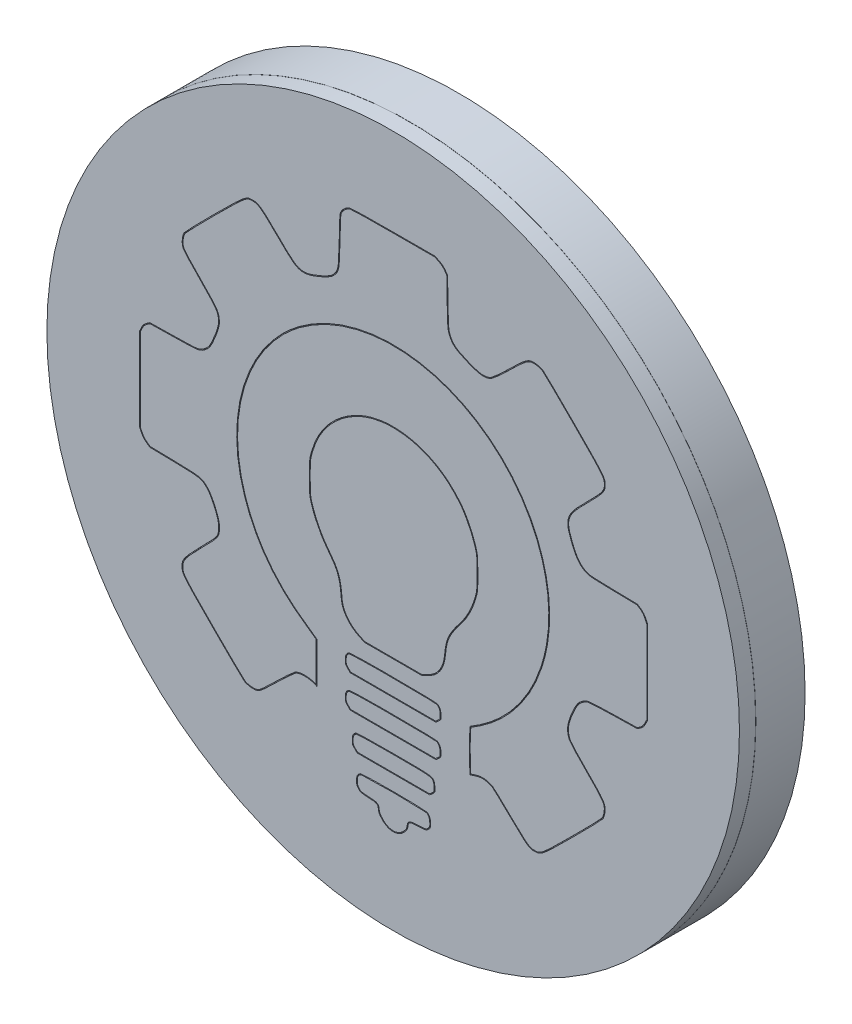
from build123d import *

# Parameters (mm, degrees)
SKETCH1_R           = 21.1
SKETCH1_R_2         = 20.1
BOSS_EXTRUDE1_DEPTH = 3
SKETCH2_R           = 21.1
BOSS_EXTRUDE3_DEPTH = 1
CUT_EXTRUDE1_DEPTH  = 0.1
SKETCH6_R           = 21.1
SKETCH6_R_2         = 21.09
CUT_EXTRUDE3_DEPTH  = 0.01
FILLET1_R           = 0.5


with BuildPart() as part:
    # Sketch1 → Boss-Extrude1 (new body)
    with BuildSketch(Plane.XY):
        Circle(SKETCH1_R)
        Circle(SKETCH1_R_2, mode=Mode.SUBTRACT)
    extrude(amount=BOSS_EXTRUDE1_DEPTH)

    # Sketch2 → Boss-Extrude3 (add)
    with BuildSketch(Plane.XY.offset(3)):
        Circle(SKETCH2_R)
    extrude(amount=BOSS_EXTRUDE3_DEPTH)

    # Sketch4 → Cut-Extrude1 (cut)
    # profile 1 of 6: a face of its own
    with BuildSketch(Plane.XY.offset(4)):
        with BuildLine():
            Line((-2.342290872, -12.661541088), (-2.191663444, -12.812168516))
            Line((-2.191663444, -12.812168516), (0.02116665, -12.812168516))
            Line((0.02116665, -12.812168516), (2.23300416, -12.812168516))
            Line((2.23300416, -12.812168516), (2.394471964, -12.673126793))
            add(Edge.make_bspline(
                [(2.394471964, -12.673126793), (2.425127572, -12.645407899), (2.495611702, -12.577907842), (2.525315799, -12.526761781), (2.542963944, -12.469496025), (2.545835, -12.367764819), (2.545835, -12.324793116)],
                knots=[0.001502606, 0.001502606, 0.001502606, 0.001502606, 0.251126954, 0.500751303, 0.750375651, 1, 1, 1, 1], degree=3))
            add(Edge.make_bspline(
                [(2.545835, -12.324793116), (2.545835, -12.291014242), (2.542668239, -12.2250183), (2.530351392, -12.117234243), (2.509833152, -12.022486306), (2.500774909, -11.993817884), (2.492230324, -11.976609612)],
                knots=[0, 0, 0, 0, 0.25140005, 0.5028001, 0.75420015, 1.0056002, 1.0056002, 1.0056002, 1.0056002], degree=3))
            add(Edge.make_bspline(
                [(2.492230324, -11.976609612), (2.479608362, -11.949405493), (2.450094364, -11.888015804), (2.410430583, -11.848128921), (2.335397193, -11.811678077), (2.157137806, -11.777819212), (1.866644744, -11.757294423), (1.437976792, -11.746296922), (0.938880521, -11.742999881), (0.451624105, -11.74220883), (0.156991255, -11.742167739), (0.0160504, -11.742167716)],
                knots=[-0.001380497, -0.001380497, -0.001380497, -0.001380497, 0.123789114, 0.248958724, 0.374128335, 0.499297945, 0.624467556, 0.749637166, 0.874806777, 0.937391582, 0.999976387, 0.999976387, 0.999976387, 0.999976387], degree=3))
            add(Edge.make_bspline(
                [(0.0160504, -11.742167716), (-0.148779126, -11.742746238), (-0.49349921, -11.744314208), (-1.062432764, -11.748661633), (-1.635553665, -11.757013044), (-2.007787898, -11.770142608), (-2.192160142, -11.784221158), (-2.231506329, -11.789867718), (-2.257366711, -11.795236997)],
                knots=[3.7578e-05, 3.7578e-05, 3.7578e-05, 3.7578e-05, 0.116249514, 0.232461451, 0.464885324, 0.697309198, 0.813521134, 0.929733071, 0.929733071, 0.929733071, 0.929733071], degree=3))
            add(Edge.make_bspline(
                [(-2.257366711, -11.795236997), (-2.295871406, -11.816745946), (-2.373655473, -11.869629648), (-2.440553207, -11.961309638), (-2.483029743, -12.07859113), (-2.4929183, -12.207988063), (-2.4929183, -12.266584716)],
                knots=[0.001930961, 0.001930961, 0.001930961, 0.001930961, 0.251448221, 0.500965481, 0.75048274, 1, 1, 1, 1], degree=3))
            add(Edge.make_bspline(
                [(-2.4929183, -12.266584716), (-2.4929183, -12.315559205), (-2.490128103, -12.430462702), (-2.471421549, -12.500536324), (-2.440509414, -12.559229275), (-2.372381095, -12.631450865), (-2.342290872, -12.661541088)],
                knots=[0, 0, 0, 0, 0.25, 0.5, 0.75, 1, 1, 1, 1], degree=3))
        make_face()
        with BuildLine():
            Line((-2.306935533, -12.626185749), (-2.170952766, -12.762168516))
            Line((-2.170952766, -12.762168516), (0.02116665, -12.762168516))
            Line((0.02116665, -12.762168516), (2.21444304, -12.762168516))
            Line((2.21444304, -12.762168516), (2.361386899, -12.635633524))
            add(Edge.make_bspline(
                [(2.361386899, -12.635633524), (2.390687258, -12.60914005), (2.460516753, -12.5415495), (2.477877679, -12.50654733), (2.492700012, -12.467070308), (2.495835, -12.366022721), (2.495835, -12.324793116)],
                knots=[0.002776637, 0.002776637, 0.002776637, 0.002776637, 0.252082478, 0.501388319, 0.750694159, 1, 1, 1, 1], degree=3))
            add(Edge.make_bspline(
                [(2.495835, -12.324793116), (2.495835, -12.292264896), (2.492718861, -12.228659618), (2.481011568, -12.125110337), (2.460396829, -12.031616254), (2.454105311, -12.012160561), (2.447162324, -11.998274615)],
                knots=[0, 0, 0, 0, 0.252268953, 0.504537906, 0.756806859, 1.009075812, 1.009075812, 1.009075812, 1.009075812], degree=3))
            add(Edge.make_bspline(
                [(2.447162324, -11.998274615), (2.435255338, -11.972555529), (2.402739179, -11.909339564), (2.386470783, -11.894826029), (2.322622941, -11.859841593), (2.153397698, -11.827960925), (1.865784274, -11.807252247), (1.438541196, -11.796324237), (0.939539951, -11.792999996), (0.452119842, -11.792209409), (0.157197708, -11.792167739), (0.016138141, -11.792167716)],
                knots=[-0.002387292, -0.002387292, -0.002387292, -0.002387292, 0.122906544, 0.24820038, 0.373494216, 0.498788052, 0.624081889, 0.749375725, 0.874669561, 0.937316479, 0.999963397, 0.999963397, 0.999963397, 0.999963397], degree=3))
            add(Edge.make_bspline(
                [(0.016138141, -11.792167716), (-0.146640051, -11.792739038), (-0.486831685, -11.794288045), (-1.050115105, -11.798518653), (-1.620175953, -11.80692523), (-1.988483326, -11.818902937), (-2.18179832, -11.833876678), (-2.215443731, -11.83759905), (-2.23968529, -11.84263222)],
                knots=[5.8193e-05, 5.8193e-05, 5.8193e-05, 5.8193e-05, 0.114785261, 0.229512329, 0.458966464, 0.6884206, 0.803147668, 0.917874736, 0.917874736, 0.917874736, 0.917874736], degree=3))
            add(Edge.make_bspline(
                [(-2.23968529, -11.84263222), (-2.274054184, -11.861830886), (-2.344188732, -11.912195278), (-2.395796391, -11.986681182), (-2.433688836, -12.08927062), (-2.4429183, -12.211814566), (-2.4429183, -12.266584716)],
                knots=[0.017891349, 0.017891349, 0.017891349, 0.017891349, 0.263418512, 0.508945675, 0.754472837, 1, 1, 1, 1], degree=3))
            add(Edge.make_bspline(
                [(-2.4429183, -12.266584716), (-2.4429183, -12.313999832), (-2.440011093, -12.428111515), (-2.423144347, -12.483064693), (-2.403233566, -12.525077064), (-2.335759051, -12.597362231), (-2.306935533, -12.626185749)],
                knots=[0, 0, 0, 0, 0.25, 0.5, 0.75, 1, 1, 1, 1], degree=3))
        make_face(mode=Mode.SUBTRACT)
    # profile 2 of 6: a face of its own
    with BuildSketch(Plane.XY.offset(4)):
        with BuildLine():
            Line((-13.391433357, 3.603691091), (-14.822619742, 3.577763896))
            Line((-14.822619742, 3.577763896), (-15.019832943, 3.446288429))
            add(Edge.make_bspline(
                [(-15.019832943, 3.446288429), (-15.053767479, 3.422833459), (-15.120162382, 3.371297507), (-15.202642909, 3.286467592), (-15.275141149, 3.188175282), (-15.320607209, 3.104262793), (-15.340178783, 3.062817161)],
                knots=[0.001432017, 0.001432017, 0.001432017, 0.001432017, 0.251178359, 0.500924702, 0.750671044, 1.000417386, 1.000417386, 1.000417386, 1.000417386], degree=3))
            Line((-15.340178783, 3.062817161), (-15.4575098, 2.808585496))
            Line((-15.4575098, 2.808585496), (-15.4575098, 0.285256434))
            Line((-15.4575098, 0.285256434), (-15.4575098, -2.231553157))
            Line((-15.4575098, -2.231553157), (-15.335863581, -2.479722508))
            add(Edge.make_bspline(
                [(-15.335863581, -2.479722508), (-15.316197155, -2.519055324), (-15.272053429, -2.595128326), (-15.192353104, -2.701984547), (-15.103516072, -2.794231087), (-15.046090061, -2.839199524), (-15.014435116, -2.859955845)],
                knots=[-0.000393202, -0.000393202, -0.000393202, -0.000393202, 0.250580185, 0.501553571, 0.752526958, 1.003500345, 1.003500345, 1.003500345, 1.003500345], degree=3))
            Line((-15.014435116, -2.859955845), (-14.821114453, -2.996694899))
            Line((-14.821114453, -2.996694899), (-13.391433416, -3.022594823))
            add(Edge.make_bspline(
                [(-13.391433416, -3.022594823), (-13.294246278, -3.024463815), (-13.091393942, -3.028439129), (-12.753545088, -3.036092217), (-12.402745923, -3.047488722), (-12.087850204, -3.06867636), (-11.7719585, -3.11400039), (-11.510973676, -3.221869212), (-11.354769503, -3.399485499), (-11.279994439, -3.486128655)],
                knots=[-2.7785e-05, -2.7785e-05, -2.7785e-05, -2.7785e-05, 0.062487371, 0.125002526, 0.250032838, 0.375063149, 0.50009346, 0.750154082, 1.000214704, 1.000214704, 1.000214704, 1.000214704], degree=3))
            add(Edge.make_bspline(
                [(-11.279994439, -3.486128655), (-11.207934055, -3.570827505), (-11.101130272, -3.741364634), (-10.901748409, -4.129914628), (-10.736470358, -4.547128493), (-10.670778343, -4.766474776), (-10.649113918, -4.887312734)],
                knots=[-0.000387178, -0.000387178, -0.000387178, -0.000387178, 0.24949243, 0.499372039, 0.749251648, 0.999131256, 0.999131256, 0.999131256, 0.999131256], degree=3))
            add(Edge.make_bspline(
                [(-10.649113918, -4.887312734), (-10.641070739, -4.9279778), (-10.631642407, -5.007974228), (-10.628396487, -5.144215382), (-10.636170775, -5.282383786), (-10.647188533, -5.365342714), (-10.654686722, -5.407543087)],
                knots=[0.002368176, 0.002368176, 0.002368176, 0.002368176, 0.253294903, 0.504221631, 0.755148358, 1.006075086, 1.006075086, 1.006075086, 1.006075086], degree=3))
            add(Edge.make_bspline(
                [(-10.654686722, -5.407543087), (-10.669545242, -5.471203611), (-10.70502807, -5.587601656), (-10.846446232, -5.791939677), (-11.091676395, -6.058531139), (-11.39154968, -6.366279255), (-11.608025511, -6.584676235), (-11.708256913, -6.685500938)],
                knots=[-0.003933307, -0.003933307, -0.003933307, -0.003933307, 0.247042642, 0.498018591, 0.74899454, 0.874482514, 0.999970489, 0.999970489, 0.999970489, 0.999970489], degree=3))
            add(Edge.make_bspline(
                [(-11.708256913, -6.685500938), (-11.821136034, -6.799575217), (-12.062016145, -7.045277937), (-12.407573179, -7.411235418), (-12.697313114, -7.755394739), (-12.842737586, -8.021202062), (-12.863366352, -8.170900999), (-12.864591488, -8.250932045)],
                knots=[2.6443e-05, 2.6443e-05, 2.6443e-05, 2.6443e-05, 0.124942881, 0.24985932, 0.499692196, 0.749525073, 0.99935795, 0.99935795, 0.99935795, 0.99935795], degree=3))
            add(Edge.make_bspline(
                [(-12.864591488, -8.250932045), (-12.864587858, -8.302525396), (-12.863534108, -8.414421265), (-12.836013972, -8.568076302), (-12.729656259, -8.76195352), (-12.435428822, -9.104412626), (-12.104517036, -9.455794375), (-11.715406065, -9.853385484), (-11.334655547, -10.238511872), (-11.104192078, -10.470962917), (-10.993927673, -10.582159139)],
                knots=[0.000454981, 0.000454981, 0.000454981, 0.000454981, 0.125396965, 0.25033895, 0.500222919, 0.625164903, 0.750106887, 0.875048872, 0.937519864, 0.999990856, 0.999990856, 0.999990856, 0.999990856], degree=3))
            add(Edge.make_bspline(
                [(-10.993927673, -10.582159139), (-10.764590773, -10.812735374), (-10.282981194, -11.293943078), (-9.68485285, -11.882123504), (-9.317866227, -12.236234811), (-9.119024862, -12.417621318), (-9.090632966, -12.443441153), (-9.065408003, -12.461713596)],
                knots=[1.7751e-05, 1.7751e-05, 1.7751e-05, 1.7751e-05, 0.245051087, 0.490084424, 0.735117761, 0.857634429, 0.980151097, 0.980151097, 0.980151097, 0.980151097], degree=3))
            add(Edge.make_bspline(
                [(-9.065408003, -12.461713596), (-9.011512621, -12.494876335), (-8.901591015, -12.540510483), (-8.674247353, -12.588581955), (-8.439337552, -12.59295026), (-8.316083387, -12.572664546), (-8.253589031, -12.552293746)],
                knots=[-0.000664527, -0.000664527, -0.000664527, -0.000664527, 0.249725182, 0.50011489, 0.750504599, 1.000894307, 1.000894307, 1.000894307, 1.000894307], degree=3))
            add(Edge.make_bspline(
                [(-8.253589031, -12.552293746), (-8.210108199, -12.538745309), (-8.159869696, -12.508064834), (-7.929814982, -12.330032765), (-7.655392752, -12.075872483), (-7.371358019, -11.802936054), (-7.192459588, -11.627607685), (-7.108021152, -11.544393171)],
                knots=[-0.001330238, -0.001330238, -0.001330238, -0.001330238, 0.249012454, 0.499355146, 0.749697838, 0.874869184, 1.000040531, 1.000040531, 1.000040531, 1.000040531], degree=3))
            add(Edge.make_bspline(
                [(-7.108021152, -11.544393171), (-6.976811688, -11.415756926), (-6.702463744, -11.150742289), (-6.345386701, -10.817275356), (-6.115227115, -10.611682349), (-5.984957287, -10.50603717), (-5.945800171, -10.477034837), (-5.920493588, -10.463678904)],
                knots=[-5.6573e-05, -5.6573e-05, -5.6573e-05, -5.6573e-05, 0.2498846, 0.499825773, 0.749766946, 0.874737533, 0.999708119, 0.999708119, 0.999708119, 0.999708119], degree=3))
            add(Edge.make_bspline(
                [(-5.920493588, -10.463678904), (-5.839659481, -10.42081927), (-5.668355306, -10.369074529), (-5.359579448, -10.345167957), (-5.041376198, -10.379513666), (-4.850143291, -10.436253325), (-4.758100854, -10.47694501)],
                knots=[0.000147306, 0.000147306, 0.000147306, 0.000147306, 0.250375164, 0.500603021, 0.750830879, 1.001058736, 1.001058736, 1.001058736, 1.001058736], degree=3))
            Line((-4.758100854, -10.47694501), (-4.6508362, -10.527153946))
            Line((-4.6508362, -10.527153946), (-4.6508362, -9.361457916))
            add(Edge.make_bspline(
                [(-4.6508362, -9.361457916), (-4.6508362, -9.212894581), (-4.65033793, -8.901790774), (-4.648519098, -8.519000966), (-4.645618161, -8.202439107), (-4.643894805, -8.102494379), (-4.642368387, -8.038648085)],
                knots=[0, 0, 0, 0, 0.214168427, 0.428336854, 0.642505281, 0.856673708, 0.856673708, 0.856673708, 0.856673708], degree=3))
            add(Edge.make_bspline(
                [(-4.642368387, -8.038648085), (-4.67268427, -8.013996786), (-4.726307407, -7.971332706), (-4.855771812, -7.876227432), (-5.01586943, -7.762887352), (-5.142990815, -7.676082175), (-5.204469944, -7.634774892)],
                knots=[0.237672673, 0.237672673, 0.237672673, 0.237672673, 0.428231768, 0.618790864, 0.809349959, 0.999909054, 0.999909054, 0.999909054, 0.999909054], degree=3))
            add(Edge.make_bspline(
                [(-5.204469944, -7.634774892), (-5.655562996, -7.333169582), (-6.526234696, -6.651078554), (-7.579480582, -5.492487804), (-8.419504078, -4.17947353), (-8.838861936, -3.179399333), (-9.006109208, -2.672453292)],
                knots=[1.6826e-05, 1.6826e-05, 1.6826e-05, 1.6826e-05, 0.250009137, 0.500001448, 0.749993759, 0.99998607, 0.99998607, 0.99998607, 0.99998607], degree=3))
            add(Edge.make_bspline(
                [(-9.006109208, -2.672453292), (-9.163364587, -2.198681736), (-9.402777074, -1.217800939), (-9.559704692, 0.742977167), (-9.18941326, 3.169809424), (-8.113449294, 5.375921067), (-6.86957431, 6.898673941), (-6.115396252, 7.568734959), (-5.716891046, 7.868772636)],
                knots=[7.568e-06, 7.568e-06, 7.568e-06, 7.568e-06, 0.125007306, 0.250007044, 0.500006521, 0.750005998, 0.875005736, 1.000005475, 1.000005475, 1.000005475, 1.000005475], degree=3))
            add(Edge.make_bspline(
                [(-5.716891046, 7.868772636), (-5.327652615, 8.161029199), (-4.497040745, 8.690527226), (-2.747712056, 9.460754852), (-0.414151518, 9.910836064), (1.951331399, 9.659752783), (3.763727993, 9.039898092), (4.639417219, 8.581985677), (5.053553633, 8.323482831)],
                knots=[-5.596e-06, -5.596e-06, -5.596e-06, -5.596e-06, 0.124994784, 0.249995165, 0.499995925, 0.749996685, 0.874997066, 0.999997446, 0.999997446, 0.999997446, 0.999997446], degree=3))
            add(Edge.make_bspline(
                [(5.053553633, 8.323482831), (5.505420609, 8.041805015), (6.367635266, 7.393612302), (7.802386549, 5.867954855), (9.073620087, 3.581611309), (9.556373555, 1.007246262), (9.427898793, -1.089145711), (9.178924649, -2.143406727), (9.011467881, -2.65108362)],
                knots=[2.342e-06, 2.342e-06, 2.342e-06, 2.342e-06, 0.125000907, 0.249999472, 0.499996603, 0.749993733, 0.874992298, 0.999990863, 0.999990863, 0.999990863, 0.999990863], degree=3))
            add(Edge.make_bspline(
                [(9.011467881, -2.65108362), (8.846576393, -3.154961366), (8.431166248, -4.143853785), (7.590498205, -5.467461763), (6.542976511, -6.634634737), (5.702937019, -7.302458475), (5.262416308, -7.597908804)],
                knots=[1.8444e-05, 1.8444e-05, 1.8444e-05, 1.8444e-05, 0.25002731, 0.500036177, 0.750045043, 1.00005391, 1.00005391, 1.00005391, 1.00005391], degree=3))
            add(Edge.make_bspline(
                [(5.262416308, -7.597908804), (5.20202035, -7.637812886), (5.07671601, -7.720142391), (4.913764922, -7.825367069), (4.778953622, -7.910499236), (4.719985081, -7.945201866), (4.686198343, -7.964555984)],
                knots=[-0.000318378, -0.000318378, -0.000318378, -0.000318378, 0.209988773, 0.420295924, 0.630603074, 0.840910225, 0.840910225, 0.840910225, 0.840910225], degree=3))
            add(Edge.make_bspline(
                [(4.686198343, -7.964555984), (4.677058547, -8.026924509), (4.666651429, -8.126497374), (4.651100167, -8.432760704), (4.642620716, -8.793151983), (4.639276678, -9.194820657), (4.641592908, -9.602213674), (4.649186714, -9.980967993), (4.662549878, -10.313572372), (4.67420021, -10.45132502), (4.681598538, -10.530535911)],
                knots=[0.084414832, 0.084414832, 0.084414832, 0.084414832, 0.182639592, 0.280864352, 0.379089113, 0.477313873, 0.575538633, 0.673763393, 0.771988153, 0.870212914, 0.870212914, 0.870212914, 0.870212914], degree=3))
            add(Edge.make_bspline(
                [(4.681598538, -10.530535911), (4.703814706, -10.523362201), (4.748251716, -10.509070162), (4.814873874, -10.487283353), (4.890136789, -10.462337781), (4.941847184, -10.445101405), (4.967506898, -10.436548179)],
                knots=[0.405047912, 0.405047912, 0.405047912, 0.405047912, 0.553072609, 0.701097306, 0.849122003, 0.9971467, 0.9971467, 0.9971467, 0.9971467], degree=3))
            add(Edge.make_bspline(
                [(4.967506898, -10.436548179), (5.05513815, -10.404328443), (5.240757405, -10.353335755), (5.501977103, -10.337278106), (5.756720802, -10.376081826), (5.921903843, -10.44062832), (6.000002532, -10.479592866)],
                knots=[0.001378849, 0.001378849, 0.001378849, 0.001378849, 0.251656139, 0.501933429, 0.75221072, 1.00248801, 1.00248801, 1.00248801, 1.00248801], degree=3))
            add(Edge.make_bspline(
                [(6.000002532, -10.479592866), (6.021382547, -10.491716303), (6.053516781, -10.515448918), (6.173049954, -10.614143695), (6.391561218, -10.810493316), (6.737208626, -11.134690679), (7.006538258, -11.396577107), (7.134714329, -11.523458222)],
                knots=[-0.010426086, -0.010426086, -0.010426086, -0.010426086, 0.11587593, 0.242177947, 0.494781981, 0.747386015, 0.999990048, 0.999990048, 0.999990048, 0.999990048], degree=3))
            add(Edge.make_bspline(
                [(7.134714329, -11.523458222), (7.243154179, -11.630706314), (7.477072172, -11.860280102), (7.820757453, -12.186457807), (8.138600147, -12.456467385), (8.373261548, -12.58504102), (8.506855376, -12.600501716), (8.5777971, -12.600501716)],
                knots=[5.378e-06, 5.378e-06, 5.378e-06, 5.378e-06, 0.125004706, 0.250004033, 0.500002689, 0.750001344, 1, 1, 1, 1], degree=3))
            add(Edge.make_bspline(
                [(8.5777971, -12.600501716), (8.628340932, -12.600501716), (8.737753274, -12.599315391), (8.889474871, -12.571411091), (9.083790332, -12.464044171), (9.42624862, -12.169360596), (9.777184609, -11.838493857), (10.173595781, -11.449890552), (10.557171585, -11.069829555), (10.788463796, -10.839917811), (10.899114175, -10.72988906)],
                knots=[0, 0, 0, 0, 0.124999857, 0.249999714, 0.499999428, 0.624999286, 0.749999143, 0.874999, 0.937498928, 0.999998857, 0.999998857, 0.999998857, 0.999998857], degree=3))
            add(Edge.make_bspline(
                [(10.899114175, -10.72988906), (11.129314297, -10.500926554), (11.609665671, -10.020179213), (12.197178963, -9.42275936), (12.551403137, -9.055704085), (12.733300509, -8.856412022), (12.759779002, -8.827394207), (12.77831114, -8.801885771)],
                knots=[2.189e-06, 2.189e-06, 2.189e-06, 2.189e-06, 0.24460669, 0.489211191, 0.733815692, 0.856117943, 0.978420194, 0.978420194, 0.978420194, 0.978420194], degree=3))
            add(Edge.make_bspline(
                [(12.77831114, -8.801885771), (12.792438001, -8.780053382), (12.812258065, -8.740149166), (12.851470312, -8.633990768), (12.883235919, -8.515120465), (12.897100267, -8.443688216), (12.902469956, -8.40658025)],
                knots=[-0.01093989, -0.01093989, -0.01093989, -0.01093989, 0.241047057, 0.493034005, 0.745020952, 0.997007899, 0.997007899, 0.997007899, 0.997007899], degree=3))
            add(Edge.make_bspline(
                [(12.902469956, -8.40658025), (12.908717832, -8.35345611), (12.918306473, -8.239522995), (12.904886414, -8.06780108), (12.83596493, -7.895821844), (12.658079829, -7.654641252), (12.457297867, -7.425409983), (12.194084589, -7.148364851), (11.938277162, -6.889651641), (11.81958531, -6.770368799)],
                knots=[0.000779328, 0.000779328, 0.000779328, 0.000779328, 0.125678582, 0.250577837, 0.500376345, 0.625275599, 0.750174853, 0.875074107, 0.999973361, 0.999973361, 0.999973361, 0.999973361], degree=3))
            add(Edge.make_bspline(
                [(11.81958531, -6.770368799), (11.686699523, -6.637481253), (11.408418736, -6.352737887), (11.091571055, -6.014183968), (10.857075106, -5.737845898), (10.794057565, -5.662279426), (10.766783387, -5.601888726)],
                knots=[5.0388e-05, 5.0388e-05, 5.0388e-05, 5.0388e-05, 0.251218125, 0.502385863, 0.7535536, 1.004721337, 1.004721337, 1.004721337, 1.004721337], degree=3))
            add(Edge.make_bspline(
                [(10.766783387, -5.601888726), (10.729890341, -5.513784425), (10.676498228, -5.329925098), (10.673752551, -5.030513246), (10.737769566, -4.707754756), (10.836364168, -4.430042933), (10.887461513, -4.302290299)],
                knots=[-0.001241914, -0.001241914, -0.001241914, -0.001241914, 0.249101817, 0.499445548, 0.749789278, 1.000133009, 1.000133009, 1.000133009, 1.000133009], degree=3))
            add(Edge.make_bspline(
                [(10.887461513, -4.302290299), (10.921880177, -4.217475516), (10.996647452, -4.039053901), (11.125665808, -3.763681326), (11.287155061, -3.496008967), (11.509674055, -3.278507815), (11.711259912, -3.17144577), (11.812152936, -3.126700715)],
                knots=[-0.000101462, -0.000101462, -0.000101462, -0.000101462, 0.124846671, 0.249794804, 0.499691069, 0.749587334, 0.9994836, 0.9994836, 0.9994836, 0.9994836], degree=3))
            add(Edge.make_bspline(
                [(11.812152936, -3.126700715), (11.869736382, -3.100493455), (11.962695567, -3.094790479), (12.317268519, -3.063057777), (12.795026184, -3.042955742), (13.237987791, -3.031528997), (13.443961285, -3.027891465)],
                knots=[0.001592964, 0.001592964, 0.001592964, 0.001592964, 0.251157691, 0.500722417, 0.750287144, 0.99985187, 0.99985187, 0.99985187, 0.99985187], degree=3))
            Line((13.443961285, -3.027891465), (14.875062277, -2.996781394))
            Line((14.875062277, -2.996781394), (15.063270254, -2.869747012))
            add(Edge.make_bspline(
                [(15.063270254, -2.869747012), (15.094614635, -2.849208174), (15.152196774, -2.804568939), (15.238506079, -2.715906635), (15.316852633, -2.611384733), (15.363122334, -2.531038737), (15.383486428, -2.490310515)],
                knots=[-0.000596767, -0.000596767, -0.000596767, -0.000596767, 0.249643229, 0.499883224, 0.750123219, 1.000363215, 1.000363215, 1.000363215, 1.000363215], degree=3))
            Line((15.383486428, -2.490310515), (15.510427746, -2.231535445))
            Line((15.510427746, -2.231535445), (15.510427746, 0.285258472))
            Line((15.510427746, 0.285258472), (15.510427746, 2.808587598))
            Line((15.510427746, 2.808587598), (15.393097495, 3.06281597))
            add(Edge.make_bspline(
                [(15.393097495, 3.06281597), (15.373525924, 3.104261598), (15.32805986, 3.188174076), (15.25556163, 3.286466366), (15.173081109, 3.371296271), (15.106686214, 3.422832216), (15.072751682, 3.446287183)],
                knots=[-0.00041727, -0.00041727, -0.00041727, -0.00041727, 0.249329043, 0.499075356, 0.74882167, 0.998567983, 0.998567983, 0.998567983, 0.998567983], degree=3))
            Line((15.072751682, 3.446287183), (14.875538484, 3.577762649))
            Line((14.875538484, 3.577762649), (13.444184964, 3.60369306))
            add(Edge.make_bspline(
                [(13.444184964, 3.60369306), (13.290933872, 3.606640211), (12.958564614, 3.613301495), (12.500854481, 3.625109694), (12.123015281, 3.642950155), (11.881222176, 3.681636652), (11.774400994, 3.729256924), (11.717488407, 3.75769388)],
                knots=[7.152e-06, 7.152e-06, 7.152e-06, 7.152e-06, 0.125248569, 0.250489987, 0.500972822, 0.751455657, 1.001938491, 1.001938491, 1.001938491, 1.001938491], degree=3))
            add(Edge.make_bspline(
                [(11.717488407, 3.75769388), (11.633547022, 3.802511425), (11.475395402, 3.907761389), (11.276708195, 4.131822518), (11.103988751, 4.422279702), (10.974715891, 4.718766447), (10.919097253, 4.857216234)],
                knots=[-0.001256008, -0.001256008, -0.001256008, -0.001256008, 0.249083189, 0.499422385, 0.749761582, 1.000100779, 1.000100779, 1.000100779, 1.000100779], degree=3))
            add(Edge.make_bspline(
                [(10.919097253, 4.857216234), (10.872510408, 4.974593926), (10.77732082, 5.226171132), (10.671297818, 5.620883388), (10.691356192, 5.987444794), (10.882982034, 6.351277358), (11.108309515, 6.646275181), (11.374257398, 6.934972838), (11.63310649, 7.198666846), (11.78781376, 7.352381506), (11.862440724, 7.426067891)],
                knots=[-5.9685e-05, -5.9685e-05, -5.9685e-05, -5.9685e-05, 0.12494725, 0.249954184, 0.499968054, 0.624974988, 0.749981923, 0.874988858, 0.937492325, 0.999995792, 0.999995792, 0.999995792, 0.999995792], degree=3))
            add(Edge.make_bspline(
                [(11.862440724, 7.426067891), (11.964694913, 7.527126253), (12.182663146, 7.744608513), (12.497044587, 8.070609266), (12.762116033, 8.379732477), (12.89653837, 8.621489406), (12.916290352, 8.758777701), (12.917510225, 8.832084317)],
                knots=[5.718e-06, 5.718e-06, 5.718e-06, 5.718e-06, 0.124911706, 0.249817695, 0.499629671, 0.749441648, 0.999253624, 0.999253624, 0.999253624, 0.999253624], degree=3))
            add(Edge.make_bspline(
                [(12.917510225, 8.832084317), (12.917506287, 8.883669276), (12.916450306, 8.995542372), (12.888922919, 9.149199076), (12.782551346, 9.343079236), (12.488317065, 9.685540953), (12.157406361, 10.036919691), (11.768302186, 10.434503434), (11.38756289, 10.819618388), (11.157107195, 11.05206159), (11.046846411, 11.163254161)],
                knots=[0.000490523, 0.000490523, 0.000490523, 0.000490523, 0.125428064, 0.250365606, 0.500240689, 0.625178231, 0.750115773, 0.875053314, 0.937522085, 0.999990856, 0.999990856, 0.999990856, 0.999990856], degree=3))
            add(Edge.make_bspline(
                [(11.046846411, 11.163254161), (10.81789346, 11.393444372), (10.337157406, 11.873784283), (9.739751516, 12.461283401), (9.372706081, 12.815497777), (9.173419334, 12.997390126), (9.144402103, 13.023867995), (9.118894293, 13.042399678)],
                knots=[1.7751e-05, 1.7751e-05, 1.7751e-05, 1.7751e-05, 0.244618371, 0.489218991, 0.733819611, 0.856119921, 0.978420231, 0.978420231, 0.978420231, 0.978420231], degree=3))
            add(Edge.make_bspline(
                [(9.118894293, 13.042399678), (9.097061911, 13.056526535), (9.057157712, 13.076346592), (8.950999327, 13.115558838), (8.832129072, 13.14732444), (8.760696812, 13.161188785), (8.723588847, 13.166558483)],
                knots=[-0.010939891, -0.010939891, -0.010939891, -0.010939891, 0.241047005, 0.493033902, 0.745020798, 0.997007694, 0.997007694, 0.997007694, 0.997007694], degree=3))
            add(Edge.make_bspline(
                [(8.723588847, 13.166558483), (8.670296991, 13.172825718), (8.556267344, 13.182395046), (8.382416259, 13.169109389), (8.207825308, 13.100409808), (7.964994232, 12.924135773), (7.735089755, 12.725291922), (7.458091785, 12.464597897), (7.200447986, 12.211440478), (7.081670725, 12.093845445)],
                knots=[0.000781401, 0.000781401, 0.000781401, 0.000781401, 0.125689365, 0.25059733, 0.500413258, 0.625321223, 0.750229187, 0.875137151, 1.000045115, 1.000045115, 1.000045115, 1.000045115], degree=3))
            add(Edge.make_bspline(
                [(7.081670725, 12.093845445), (6.94572471, 11.960372154), (6.653249522, 11.6785785), (6.316320117, 11.367290144), (6.041761942, 11.138207744), (5.959334046, 11.073617476), (5.896773109, 11.046339596)],
                knots=[-8.2146e-05, -8.2146e-05, -8.2146e-05, -8.2146e-05, 0.250770591, 0.501623328, 0.752476066, 1.003328803, 1.003328803, 1.003328803, 1.003328803], degree=3))
            add(Edge.make_bspline(
                [(5.896773109, 11.046339596), (5.812617236, 11.011886382), (5.636730011, 10.958936691), (5.358044964, 10.958674825), (5.084294014, 11.023726455), (4.82802784, 11.112312944), (4.671451807, 11.174273622), (4.597410219, 11.204761233)],
                knots=[-0.001028851, -0.001028851, -0.001028851, -0.001028851, 0.249230637, 0.499490125, 0.749749613, 0.874879357, 1.000009101, 1.000009101, 1.000009101, 1.000009101], degree=3))
            add(Edge.make_bspline(
                [(4.597410219, 11.204761233), (4.5172965, 11.237785265), (4.348227542, 11.309165734), (4.088978576, 11.428773197), (3.839844997, 11.570588977), (3.637853657, 11.758219553), (3.543036647, 11.921223912), (3.503173753, 12.004772628)],
                knots=[-8.19e-06, -8.19e-06, -8.19e-06, -8.19e-06, 0.124890002, 0.249788193, 0.499584575, 0.749380958, 0.99917734, 0.99917734, 0.99917734, 0.99917734], degree=3))
            add(Edge.make_bspline(
                [(3.503173753, 12.004772628), (3.472479672, 12.066215746), (3.418398851, 12.184486393), (3.377609435, 12.427773591), (3.360198113, 12.800836037), (3.349019605, 13.253066341), (3.342535596, 13.582901738), (3.339602067, 13.734858287)],
                knots=[0.001158335, 0.001158335, 0.001158335, 0.001158335, 0.250875166, 0.500591997, 0.750308828, 0.875167243, 1.000025659, 1.000025659, 1.000025659, 1.000025659], degree=3))
            Line((3.339602067, 13.734858287), (3.313689934, 15.139298935))
            Line((3.313689934, 15.139298935), (3.186755534, 15.327358792))
            add(Edge.make_bspline(
                [(3.186755534, 15.327358792), (3.166216696, 15.358703173), (3.121577461, 15.416285312), (3.032915156, 15.502594617), (2.928393255, 15.580941171), (2.848047259, 15.627210872), (2.807319037, 15.647574966)],
                knots=[-0.000596767, -0.000596767, -0.000596767, -0.000596767, 0.249643229, 0.499883224, 0.75012322, 1.000363215, 1.000363215, 1.000363215, 1.000363215], degree=3))
            Line((2.807319037, 15.647574966), (2.54864255, 15.774467921))
            Line((2.54864255, 15.774467921), (0.031697966, 15.769224584))
            add(Edge.make_bspline(
                [(0.031697966, 15.769224584), (-0.157688912, 15.769224527), (-0.551860432, 15.768601588), (-1.217015472, 15.765018599), (-1.901614872, 15.755860287), (-2.346738426, 15.742604367), (-2.576165502, 15.726365288), (-2.611331874, 15.722545591), (-2.638334703, 15.716961795)],
                knots=[1.1059e-05, 1.1059e-05, 1.1059e-05, 1.1059e-05, 0.120693588, 0.241376116, 0.482741173, 0.724106229, 0.844788758, 0.965471286, 0.965471286, 0.965471286, 0.965471286], degree=3))
            add(Edge.make_bspline(
                [(-2.638334703, 15.716961795), (-2.692277141, 15.696799975), (-2.799699506, 15.648234593), (-2.935292277, 15.556598709), (-3.053284546, 15.444683076), (-3.123024321, 15.351190269), (-3.153610143, 15.303073688)],
                knots=[0.000574501, 0.000574501, 0.000574501, 0.000574501, 0.250154979, 0.499735457, 0.749315935, 0.998896413, 0.998896413, 0.998896413, 0.998896413], degree=3))
            add(Edge.make_bspline(
                [(-3.153610143, 15.303073688), (-3.176525838, 15.265535082), (-3.21642438, 15.196713214), (-3.248632742, 15.021197842), (-3.266331083, 14.660492683), (-3.277251416, 14.21251332), (-3.283762808, 13.88153977), (-3.286688154, 13.729422066)],
                knots=[0.001061091, 0.001061091, 0.001061091, 0.001061091, 0.250798468, 0.500535844, 0.75027322, 0.875141909, 1.000010597, 1.000010597, 1.000010597, 1.000010597], degree=3))
            add(Edge.make_bspline(
                [(-3.286688154, 13.729422066), (-3.288558473, 13.636530108), (-3.292570193, 13.442807186), (-3.300344129, 13.118912854), (-3.311736532, 12.781045347), (-3.331865309, 12.475307264), (-3.373319941, 12.16589536), (-3.467384864, 11.907300824), (-3.620035229, 11.747951448), (-3.696552383, 11.671417369)],
                knots=[-9.256e-06, -9.256e-06, -9.256e-06, -9.256e-06, 0.062466988, 0.124943232, 0.24989572, 0.374848208, 0.499800696, 0.749705672, 0.999610648, 0.999610648, 0.999610648, 0.999610648], degree=3))
            add(Edge.make_bspline(
                [(-3.696552383, 11.671417369), (-3.734962854, 11.632217521), (-3.814850221, 11.570935906), (-4.052944253, 11.424641513), (-4.434639429, 11.240703055), (-4.839482235, 11.083562523), (-5.127814516, 10.999453239), (-5.236888273, 10.977023103), (-5.296860839, 10.970251065)],
                knots=[0.000564058, 0.000564058, 0.000564058, 0.000564058, 0.125556307, 0.250548557, 0.500533057, 0.750517556, 0.875509806, 1.000502056, 1.000502056, 1.000502056, 1.000502056], degree=3))
            add(Edge.make_bspline(
                [(-5.296860839, 10.970251065), (-5.410017999, 10.958690131), (-5.642071233, 10.951883984), (-5.965870298, 11.09480291), (-6.306543231, 11.377448409), (-6.669643285, 11.722345751), (-6.918973158, 11.968781687), (-7.034355578, 12.083569328)],
                knots=[-0.000363897, -0.000363897, -0.000363897, -0.000363897, 0.249726274, 0.499816446, 0.749906617, 0.874951702, 0.999996788, 0.999996788, 0.999996788, 0.999996788], degree=3))
            add(Edge.make_bspline(
                [(-7.034355578, 12.083569328), (-7.14241881, 12.191035471), (-7.375217747, 12.420419296), (-7.721574011, 12.749067046), (-8.047327685, 13.024007033), (-8.298461753, 13.160906045), (-8.443429722, 13.180386419), (-8.520335236, 13.181597978)],
                knots=[3.451e-06, 3.451e-06, 3.451e-06, 3.451e-06, 0.124918759, 0.249834068, 0.499664685, 0.749495302, 0.999325919, 0.999325919, 0.999325919, 0.999325919], degree=3))
            add(Edge.make_bspline(
                [(-8.520335236, 13.181597978), (-8.572551283, 13.181596071), (-8.686022335, 13.180951586), (-8.801712957, 13.160832683), (-8.934243004, 13.103824692), (-9.116684459, 12.977439378), (-9.371413031, 12.758607741), (-9.721311127, 12.428446129), (-10.117888946, 12.039308596), (-10.502534881, 11.657978974), (-10.734951134, 11.42690186), (-10.846103498, 11.316370479)],
                knots=[0.00046225, 0.00046225, 0.00046225, 0.00046225, 0.125402355, 0.25034246, 0.375282565, 0.50022267, 0.625162774, 0.750102879, 0.875042984, 0.937513036, 0.999983089, 0.999983089, 0.999983089, 0.999983089], degree=3))
            add(Edge.make_bspline(
                [(-10.846103498, 11.316370479), (-11.076583514, 11.085889964), (-11.558006328, 10.602025819), (-12.14615299, 10.002467656), (-12.50030469, 9.634995339), (-12.681705295, 9.436041208), (-12.707527327, 9.407645871), (-12.725803436, 9.382414392)],
                knots=[3.2783e-05, 3.2783e-05, 3.2783e-05, 3.2783e-05, 0.245063592, 0.490094401, 0.73512521, 0.857640615, 0.98015602, 0.98015602, 0.98015602, 0.98015602], degree=3))
            add(Edge.make_bspline(
                [(-12.725803436, 9.382414392), (-12.758883178, 9.328654044), (-12.804434015, 9.219052255), (-12.852529931, 8.99220083), (-12.857113774, 8.757934304), (-12.837088523, 8.634608383), (-12.816874949, 8.572100767)],
                knots=[-0.000665745, -0.000665745, -0.000665745, -0.000665745, 0.249180996, 0.499027737, 0.748874478, 0.998721219, 0.998721219, 0.998721219, 0.998721219], degree=3))
            add(Edge.make_bspline(
                [(-12.816874949, 8.572100767), (-12.800794973, 8.526847975), (-12.767101443, 8.473486897), (-12.582264246, 8.236909212), (-12.321428198, 7.954656616), (-12.041738737, 7.663220194), (-11.862121044, 7.479885635), (-11.776825062, 7.3933711)],
                knots=[0.003094786, 0.003094786, 0.003094786, 0.003094786, 0.252322562, 0.501550338, 0.750778114, 0.875392002, 1.00000589, 1.00000589, 1.00000589, 1.00000589], degree=3))
            add(Edge.make_bspline(
                [(-11.776825062, 7.3933711), (-11.659670874, 7.274450762), (-11.406045025, 7.016201316), (-11.147754728, 6.745146737), (-10.9483585, 6.520780755), (-10.763200519, 6.277751585), (-10.647535428, 6.023804497), (-10.6420901, 5.790789196), (-10.6420901, 5.677468134)],
                knots=[-4.193e-06, -4.193e-06, -4.193e-06, -4.193e-06, 0.124996331, 0.249996855, 0.374997379, 0.499997903, 0.749998952, 1, 1, 1, 1], degree=3))
            add(Edge.make_bspline(
                [(-10.6420901, 5.677468134), (-10.6420901, 5.624798397), (-10.656354551, 5.530326952), (-10.722874829, 5.263624792), (-10.863131356, 4.865015642), (-11.033316161, 4.471420137), (-11.169208008, 4.216755835), (-11.223802623, 4.132431636), (-11.25831473, 4.088932952)],
                knots=[0, 0, 0, 0, 0.125407146, 0.250814292, 0.501628583, 0.752442875, 0.877850021, 1.003257167, 1.003257167, 1.003257167, 1.003257167], degree=3))
            add(Edge.make_bspline(
                [(-11.25831473, 4.088932952), (-11.28577954, 4.058303909), (-11.340699001, 4.002701355), (-11.447452976, 3.908174342), (-11.560175713, 3.821475462), (-11.627471097, 3.777960294), (-11.664154886, 3.757902598)],
                knots=[-0.007705863, -0.007705863, -0.007705863, -0.007705863, 0.245452307, 0.498610477, 0.751768647, 1.004926818, 1.004926818, 1.004926818, 1.004926818], degree=3))
            add(Edge.make_bspline(
                [(-11.664154886, 3.757902598), (-11.72108045, 3.729465532), (-11.827894764, 3.681733791), (-12.069640857, 3.642982454), (-12.447517156, 3.625123363), (-12.905445528, 3.613306568), (-13.23807212, 3.60664036), (-13.391433357, 3.603691091)],
                knots=[-0.002623621, -0.002623621, -0.002623621, -0.002623621, 0.24804062, 0.49870486, 0.7493691, 0.87470122, 1.00003334, 1.00003334, 1.00003334, 1.00003334], degree=3))
        make_face()
        with BuildLine():
            Line((-13.390499853, 3.553699798), (-14.807070741, 3.528037376))
            Line((-14.807070741, 3.528037376), (-14.991748854, 3.404918634))
            add(Edge.make_bspline(
                [(-14.991748854, 3.404918634), (-15.023958603, 3.382655807), (-15.087194314, 3.333502742), (-15.164413478, 3.253921519), (-15.232458324, 3.161843194), (-15.276173083, 3.081264303), (-15.294872485, 3.04166562)],
                knots=[0.002322855, 0.002322855, 0.002322855, 0.002322855, 0.251742141, 0.501161428, 0.750580714, 1, 1, 1, 1], degree=3))
            Line((-15.294872485, 3.04166562), (-15.4075098, 2.797604221))
            Line((-15.4075098, 2.797604221), (-15.4075098, 0.285256434))
            Line((-15.4075098, 0.285256434), (-15.4075098, -2.219957846))
            Line((-15.4075098, -2.219957846), (-15.291053995, -2.45753828))
            add(Edge.make_bspline(
                [(-15.291053995, -2.45753828), (-15.27225021, -2.495145817), (-15.230019347, -2.567831904), (-15.153708385, -2.67010368), (-15.068819156, -2.757975814), (-15.015788588, -2.799332272), (-14.986294349, -2.818616975)],
                knots=[0, 0, 0, 0, 0.251389654, 0.502779308, 0.754168962, 1.005558616, 1.005558616, 1.005558616, 1.005558616], degree=3))
            Line((-14.986294349, -2.818616975), (-14.804812807, -2.946982014))
            Line((-14.804812807, -2.946982014), (-13.390499911, -2.97260353))
            add(Edge.make_bspline(
                [(-13.390499911, -2.97260353), (-13.293271119, -2.974473316), (-13.090364992, -2.978449065), (-12.752172425, -2.986113166), (-12.400526111, -2.997509533), (-12.083242592, -3.01893166), (-11.760671514, -3.064566245), (-11.478013543, -3.182239788), (-11.319384667, -3.363957292), (-11.242027832, -3.453593026)],
                knots=[-3.3757e-05, -3.3757e-05, -3.3757e-05, -3.3757e-05, 0.062489449, 0.125012655, 0.250059066, 0.375105477, 0.500151889, 0.750244711, 1.000337534, 1.000337534, 1.000337534, 1.000337534], degree=3))
            add(Edge.make_bspline(
                [(-11.242027832, -3.453593026), (-11.207674477, -3.493958204), (-11.148921488, -3.574855836), (-11.018561439, -3.788388026), (-10.857975237, -4.107291142), (-10.689280342, -4.529394462), (-10.622119754, -4.754546095), (-10.599977469, -4.878049417)],
                knots=[-0.000527359, -0.000527359, -0.000527359, -0.000527359, 0.124392901, 0.249313161, 0.499153681, 0.748994201, 0.998834721, 0.998834721, 0.998834721, 0.998834721], degree=3))
            add(Edge.make_bspline(
                [(-10.599977469, -4.878049417), (-10.59150775, -4.920871005), (-10.581576915, -5.005851494), (-10.578386382, -5.146007261), (-10.586414291, -5.288023307), (-10.597901654, -5.373979154), (-10.605692302, -5.417606765)],
                knots=[0.003225677, 0.003225677, 0.003225677, 0.003225677, 0.254570237, 0.505914798, 0.757259358, 1.008603918, 1.008603918, 1.008603918, 1.008603918], degree=3))
            add(Edge.make_bspline(
                [(-10.605692302, -5.417606765), (-10.621447729, -5.485355128), (-10.659156962, -5.60941543), (-10.784448948, -5.789932689), (-10.954367264, -5.983065368), (-11.128762091, -6.168310231), (-11.323054596, -6.367525776), (-11.509024512, -6.555846158), (-11.619598517, -6.667238011), (-11.672756592, -6.720710746)],
                knots=[-0.005543247, -0.005543247, -0.005543247, -0.005543247, 0.245831167, 0.497205581, 0.622892788, 0.748579995, 0.874267202, 0.937110805, 0.999954408, 0.999954408, 0.999954408, 0.999954408], degree=3))
            add(Edge.make_bspline(
                [(-11.672756592, -6.720710746), (-11.732006398, -6.780587885), (-11.854504982, -6.904945545), (-12.063927226, -7.120370598), (-12.285533324, -7.354859068), (-12.48639615, -7.581946415), (-12.679648458, -7.827849568), (-12.794948102, -8.038579953), (-12.813450658, -8.176790861), (-12.814591462, -8.25131297)],
                knots=[4.0741e-05, 4.0741e-05, 4.0741e-05, 4.0741e-05, 0.062471231, 0.124901721, 0.249762701, 0.374623681, 0.499484661, 0.74920662, 0.99892858, 0.99892858, 0.99892858, 0.99892858], degree=3))
            add(Edge.make_bspline(
                [(-12.814591462, -8.25131297), (-12.814587923, -8.301596054), (-12.81331043, -8.413186464), (-12.794427275, -8.514090812), (-12.740917794, -8.637974785), (-12.616699115, -8.816599009), (-12.39838575, -9.070822376), (-12.068323146, -9.421290261), (-11.679605485, -9.81847992), (-11.299053946, -10.203404178), (-11.068671915, -10.435773167), (-10.958450518, -10.546926017)],
                knots=[0.000773296, 0.000773296, 0.000773296, 0.000773296, 0.125674862, 0.250576429, 0.375477995, 0.500379561, 0.625281128, 0.750182694, 0.87508426, 0.937535043, 0.999985827, 0.999985827, 0.999985827, 0.999985827], degree=3))
            add(Edge.make_bspline(
                [(-10.958450518, -10.546926017), (-10.730037917, -10.776572959), (-10.250019461, -11.256110452), (-9.754942382, -11.743318057), (-9.431925471, -12.056348795), (-9.236178197, -12.24266263), (-9.120539882, -12.349704576), (-9.055489811, -12.406081409), (-9.045788487, -12.414185682), (-9.037601268, -12.420116334)],
                knots=[2.7251e-05, 2.7251e-05, 2.7251e-05, 2.7251e-05, 0.244110931, 0.488194611, 0.610236451, 0.732278291, 0.854320131, 0.915341051, 0.976361971, 0.976361971, 0.976361971, 0.976361971], degree=3))
            add(Edge.make_bspline(
                [(-9.037601268, -12.420116334), (-8.987525363, -12.450928884), (-8.887032181, -12.492071968), (-8.666980869, -12.539036135), (-8.440593324, -12.54245461), (-8.327097624, -12.523698601), (-8.268767683, -12.504652081)],
                knots=[0.002002929, 0.002002929, 0.002002929, 0.002002929, 0.251838933, 0.501674936, 0.75151094, 1.001346943, 1.001346943, 1.001346943, 1.001346943], degree=3))
            add(Edge.make_bspline(
                [(-8.268767683, -12.504652081), (-8.255445642, -12.500517656), (-8.23806558, -12.492966276), (-8.142973696, -12.435453221), (-7.96688824, -12.294360821), (-7.689697917, -12.039731255), (-7.406540731, -11.76735701), (-7.227505617, -11.591945837), (-7.143071138, -11.508735035)],
                knots=[-0.002286545, -0.002286545, -0.002286545, -0.002286545, 0.123007203, 0.248300951, 0.498888447, 0.749475942, 0.87476969, 1.000063438, 1.000063438, 1.000063438, 1.000063438], degree=3))
            add(Edge.make_bspline(
                [(-7.143071138, -11.508735035), (-7.011685538, -11.379925637), (-6.736912383, -11.11452205), (-6.379612058, -10.780751225), (-6.147280906, -10.573429501), (-6.017468133, -10.467825792), (-5.971795473, -10.434218067), (-5.943873443, -10.419481793)],
                knots=[-8.6047e-05, -8.6047e-05, -8.6047e-05, -8.6047e-05, 0.249846695, 0.499779438, 0.749712181, 0.874678553, 0.999644924, 0.999644924, 0.999644924, 0.999644924], degree=3))
            add(Edge.make_bspline(
                [(-5.943873443, -10.419481793), (-5.858474839, -10.374201983), (-5.675567978, -10.318962611), (-5.358434525, -10.295081918), (-5.031794769, -10.330044751), (-4.832809256, -10.389198247), (-4.737386304, -10.431434668)],
                knots=[0.000188654, 0.000188654, 0.000188654, 0.000188654, 0.250514884, 0.500841113, 0.751167343, 1.001493572, 1.001493572, 1.001493572, 1.001493572], degree=3))
            Line((-4.737386304, -10.431434668), (-4.7008362, -10.44854321))
            Line((-4.7008362, -10.44854321), (-4.7008362, -9.361457916))
            add(Edge.make_bspline(
                [(-4.7008362, -9.361457916), (-4.7008362, -9.217891941), (-4.700387244, -8.918876567), (-4.69861907, -8.541656829), (-4.696534224, -8.29123476), (-4.694483184, -8.138266722), (-4.693603874, -8.089727825), (-4.69294024, -8.061969646)],
                knots=[0, 0, 0, 0, 0.206566596, 0.413133192, 0.619699788, 0.722983086, 0.826266384, 0.826266384, 0.826266384, 0.826266384], degree=3))
            add(Edge.make_bspline(
                [(-4.69294024, -8.061969646), (-4.721691204, -8.038590858), (-4.771556676, -8.000273843), (-4.901976729, -7.904506126), (-5.053771276, -7.797575958), (-5.174110793, -7.715410752), (-5.232307902, -7.676308628)],
                knots=[0.277509677, 0.277509677, 0.277509677, 0.277509677, 0.458097373, 0.638685068, 0.819272763, 0.999860458, 0.999860458, 0.999860458, 0.999860458], degree=3))
            add(Edge.make_bspline(
                [(-5.232307902, -7.676308628), (-5.685566637, -7.373255322), (-6.560208935, -6.688058572), (-7.619386183, -5.523058809), (-8.464083128, -4.202616566), (-8.885484935, -3.197670217), (-9.053577696, -2.688161401)],
                knots=[2.5476e-05, 2.5476e-05, 2.5476e-05, 2.5476e-05, 0.250013865, 0.500002254, 0.749990643, 0.999979032, 0.999979032, 0.999979032, 0.999979032], degree=3))
            add(Edge.make_bspline(
                [(-9.053577696, -2.688161401), (-9.211671019, -2.211865328), (-9.452353332, -1.225769885), (-9.610113894, 0.745537998), (-9.237847627, 3.184970288), (-8.156322821, 5.402555878), (-6.905764202, 6.933483294), (-6.147569541, 7.607101034), (-5.746938971, 7.908736661)],
                knots=[1.133e-05, 1.133e-05, 1.133e-05, 1.133e-05, 0.125010941, 0.250010551, 0.500009773, 0.750008995, 0.875008605, 1.000008216, 1.000008216, 1.000008216, 1.000008216], degree=3))
            add(Edge.make_bspline(
                [(-5.746938971, 7.908736661), (-5.355680409, 8.20251215), (-4.520799138, 8.734742864), (-2.7621398, 9.509095384), (-0.416317451, 9.961513947), (1.961563535, 9.709149828), (3.78358424, 9.085996272), (4.663744296, 8.625741901), (5.080016378, 8.365905977)],
                knots=[-8.405e-06, -8.405e-06, -8.405e-06, -8.405e-06, 0.124992167, 0.249992739, 0.499993884, 0.749995028, 0.874995601, 0.999996173, 0.999996173, 0.999996173, 0.999996173], degree=3))
            add(Edge.make_bspline(
                [(5.080016378, 8.365905977), (5.534305824, 8.082718079), (6.401131086, 7.431065134), (7.843648671, 5.897145542), (9.121444547, 3.598885635), (9.606760256, 1.011188826), (9.477603373, -1.096479695), (9.227315881, -2.156317371), (9.058969852, -2.666690229)],
                knots=[3.509e-06, 3.509e-06, 3.509e-06, 3.509e-06, 0.125001358, 0.249999208, 0.499994908, 0.749990608, 0.874988458, 0.999986308, 0.999986308, 0.999986308, 0.999986308], degree=3))
            add(Edge.make_bspline(
                [(9.058969852, -2.666690229), (8.893224072, -3.173178531), (8.475685911, -4.167113747), (7.630469254, -5.49790644), (6.577230574, -6.671373013), (5.732919828, -7.342565006), (5.290123041, -7.639530513)],
                knots=[2.7633e-05, 2.7633e-05, 2.7633e-05, 2.7633e-05, 0.250040962, 0.500054291, 0.75006762, 1.00008095, 1.00008095, 1.00008095, 1.00008095], degree=3))
            add(Edge.make_bspline(
                [(5.290123041, -7.639530513), (5.232575754, -7.677552836), (5.113304071, -7.755901765), (4.957589589, -7.856761358), (4.8213141, -7.942723298), (4.765179945, -7.976935209), (4.732145135, -7.995858598)],
                knots=[-0.000485027, -0.000485027, -0.000485027, -0.000485027, 0.199236321, 0.39895767, 0.598679018, 0.798400367, 0.798400367, 0.798400367, 0.798400367], degree=3))
            add(Edge.make_bspline(
                [(4.732145135, -7.995858598), (4.728363677, -8.021662669), (4.723398418, -8.066471032), (4.711749721, -8.212981176), (4.701015341, -8.446587281), (4.692687342, -8.791202186), (4.689445765, -9.169154711), (4.691101813, -9.554240852), (4.697705601, -9.920090097), (4.707034775, -10.184049791), (4.717180839, -10.361903612), (4.722236493, -10.42797036), (4.725582183, -10.463791306)],
                knots=[0.098871727, 0.098871727, 0.098871727, 0.098871727, 0.145400216, 0.191928704, 0.284985681, 0.378042658, 0.471099635, 0.564156612, 0.657213589, 0.750270566, 0.796799054, 0.843327543, 0.843327543, 0.843327543, 0.843327543], degree=3))
            add(Edge.make_bspline(
                [(4.725582183, -10.463791306), (4.742797787, -10.458232303), (4.776126029, -10.447368505), (4.832488171, -10.428782738), (4.890860477, -10.409391219), (4.931040175, -10.395999117), (4.950970148, -10.389355801)],
                knots=[0.53687387, 0.53687387, 0.53687387, 0.53687387, 0.651594126, 0.766314383, 0.88103464, 0.995754896, 0.995754896, 0.995754896, 0.995754896], degree=3))
            add(Edge.make_bspline(
                [(4.950970148, -10.389355801), (5.041498309, -10.356070947), (5.232753663, -10.303667448), (5.505144174, -10.286896856), (5.771242004, -10.327831892), (5.942405024, -10.394891786), (6.023481125, -10.435429856)],
                knots=[0.002040543, 0.002040543, 0.002040543, 0.002040543, 0.252450065, 0.502859588, 0.753269111, 1.003678634, 1.003678634, 1.003678634, 1.003678634], degree=3))
            add(Edge.make_bspline(
                [(6.023481125, -10.435429856), (6.047129413, -10.448732006), (6.084954734, -10.47639802), (6.204023019, -10.574927726), (6.424373387, -10.772669069), (6.770848484, -11.097685179), (7.041245552, -11.360579362), (7.169881747, -11.487915954)],
                knots=[-0.012546272, -0.012546272, -0.012546272, -0.012546272, 0.114020115, 0.240586502, 0.493719276, 0.74685205, 0.999984824, 0.999984824, 0.999984824, 0.999984824], degree=3))
            add(Edge.make_bspline(
                [(7.169881747, -11.487915954), (7.226928901, -11.544336158), (7.345500076, -11.661167689), (7.549653004, -11.86003886), (7.7702932, -12.069554134), (7.981241573, -12.257734961), (8.206559063, -12.436418144), (8.390204478, -12.537022926), (8.512427095, -12.550501716), (8.5777971, -12.550501716)],
                knots=[8.288e-06, 8.288e-06, 8.288e-06, 8.288e-06, 0.06250777, 0.125007252, 0.250006216, 0.37500518, 0.500004144, 0.750002072, 1, 1, 1, 1], degree=3))
            add(Edge.make_bspline(
                [(8.5777971, -12.550501716), (8.627005912, -12.550501716), (8.736056433, -12.549106418), (8.835473319, -12.530081127), (8.959299451, -12.476042566), (9.13810794, -12.351221523), (9.392356433, -12.132599235), (9.742390658, -11.802579868), (10.138475697, -11.414301727), (10.521935959, -11.034354797), (10.753218885, -10.804452385), (10.863858567, -10.69443427)],
                knots=[0, 0, 0, 0, 0.124999857, 0.249999714, 0.374999571, 0.499999428, 0.624999286, 0.749999143, 0.874999, 0.937498928, 0.999998857, 0.999998857, 0.999998857, 0.999998857], degree=3))
            add(Edge.make_bspline(
                [(10.863858567, -10.69443427), (11.093375398, -10.466151381), (11.572619514, -9.986428993), (12.059639321, -9.491551931), (12.372652709, -9.168565032), (12.559034732, -8.972763662), (12.666229253, -8.856976089), (12.722769623, -8.79178372), (12.731053852, -8.781865184), (12.737066108, -8.773589655)],
                knots=[2.189e-06, 2.189e-06, 2.189e-06, 2.189e-06, 0.243935921, 0.487869654, 0.60983652, 0.731803386, 0.853770253, 0.914753686, 0.975737119, 0.975737119, 0.975737119, 0.975737119], degree=3))
            add(Edge.make_bspline(
                [(12.737066108, -8.773589655), (12.749482046, -8.754401417), (12.765615455, -8.7214535), (12.80418729, -8.617742407), (12.834413839, -8.503799393), (12.847755245, -8.435563033), (12.85288999, -8.400078677)],
                knots=[-0.006009844, -0.006009844, -0.006009844, -0.006009844, 0.244357075, 0.494723995, 0.745090914, 0.995457833, 0.995457833, 0.995457833, 0.995457833], degree=3))
            add(Edge.make_bspline(
                [(12.85288999, -8.400078677), (12.858934394, -8.348684606), (12.868172544, -8.2368131), (12.855232342, -8.080562672), (12.793342089, -7.922460825), (12.618698668, -7.685630909), (12.422439004, -7.461229528), (12.195804291, -7.22305678), (11.977088764, -6.999952002), (11.846868267, -6.868674541), (11.784185954, -6.80568012)],
                knots=[0.001314798, 0.001314798, 0.001314798, 0.001314798, 0.126145306, 0.250975815, 0.500636831, 0.62546734, 0.750297848, 0.875128356, 0.93754361, 0.999958864, 0.999958864, 0.999958864, 0.999958864], degree=3))
            add(Edge.make_bspline(
                [(11.784185954, -6.80568012), (11.650952433, -6.672444836), (11.372249398, -6.387341609), (11.053219979, -6.046144473), (10.820569834, -5.772646557), (10.749994423, -5.686423848), (10.720926599, -5.621828644)],
                knots=[7.7923e-05, 7.7923e-05, 7.7923e-05, 7.7923e-05, 0.251446555, 0.502815186, 0.754183817, 1.005552449, 1.005552449, 1.005552449, 1.005552449], degree=3))
            add(Edge.make_bspline(
                [(10.720926599, -5.621828644), (10.682333427, -5.529798774), (10.626502343, -5.337574959), (10.623555561, -5.025384458), (10.689809055, -4.693136189), (10.789323444, -4.413006311), (10.84108392, -4.283605157)],
                knots=[-0.001811289, -0.001811289, -0.001811289, -0.001811289, 0.248693623, 0.499198534, 0.749703446, 1.000208358, 1.000208358, 1.000208358, 1.000208358], degree=3))
            add(Edge.make_bspline(
                [(10.84108392, -4.283605157), (10.875683899, -4.198340937), (10.950699754, -4.019286099), (11.081278598, -3.740584015), (11.246130556, -3.466163469), (11.481061992, -3.236699098), (11.68761651, -3.12723487), (11.791661343, -3.08109202)],
                knots=[-0.000158215, -0.000158215, -0.000158215, -0.000158215, 0.124774888, 0.24970799, 0.499574195, 0.7494404, 0.999306605, 0.999306605, 0.999306605, 0.999306605], degree=3))
            add(Edge.make_bspline(
                [(11.791661343, -3.08109202), (11.854393586, -3.05254145), (11.964378909, -3.0440938), (12.310238543, -3.013395453), (12.721909854, -2.996227847), (13.112015241, -2.984539658), (13.334899708, -2.979809717), (13.442874621, -2.977902859)],
                knots=[0.001884785, 0.001884785, 0.001884785, 0.001884785, 0.251356938, 0.50082909, 0.750301242, 0.875037318, 0.999773395, 0.999773395, 0.999773395, 0.999773395], degree=3))
            Line((13.442874621, -2.977902859), (14.859275597, -2.947112756))
            Line((14.859275597, -2.947112756), (15.035293851, -2.828300385))
            add(Edge.make_bspline(
                [(15.035293851, -2.828300385), (15.064547036, -2.809173305), (15.117930322, -2.767923373), (15.200076286, -2.683730075), (15.274686359, -2.584281613), (15.319165546, -2.507148914), (15.338680195, -2.468119584)],
                knots=[-0.002231974, -0.002231974, -0.002231974, -0.002231974, 0.248326019, 0.498884013, 0.749442006, 1, 1, 1, 1], degree=3))
            Line((15.338680195, -2.468119584), (15.460427746, -2.219932219))
            Line((15.460427746, -2.219932219), (15.460427746, 0.285258472))
            Line((15.460427746, 0.285258472), (15.460427746, 2.797606259))
            Line((15.460427746, 2.797606259), (15.347791223, 3.041664374))
            add(Edge.make_bspline(
                [(15.347791223, 3.041664374), (15.329091821, 3.081263057), (15.285377062, 3.161841948), (15.217332216, 3.253920274), (15.140113052, 3.333501496), (15.076877342, 3.382654561), (15.044667592, 3.404917388)],
                knots=[0, 0, 0, 0, 0.249419286, 0.498838572, 0.748257859, 0.997677145, 0.997677145, 0.997677145, 0.997677145], degree=3))
            Line((15.044667592, 3.404917388), (14.859989479, 3.52803613))
            Line((14.859989479, 3.52803613), (13.443251456, 3.553701767))
            add(Edge.make_bspline(
                [(13.443251456, 3.553701767), (13.361879043, 3.555266621), (13.192260112, 3.558597151), (12.908034395, 3.564643068), (12.611390265, 3.572206927), (12.344136898, 3.582458703), (12.079230532, 3.599503901), (11.866717526, 3.633206369), (11.75441778, 3.683327394), (11.694537353, 3.713267608)],
                knots=[0, 0, 0, 0, 0.06267372, 0.12534744, 0.25069488, 0.37604232, 0.50138976, 0.75208464, 1.00277952, 1.00277952, 1.00277952, 1.00277952], degree=3))
            add(Edge.make_bspline(
                [(11.694537353, 3.713267608), (11.60718377, 3.75985616), (11.442428319, 3.869965816), (11.236533579, 4.100180095), (11.085276514, 4.358524438), (10.966801769, 4.610719748), (10.902451006, 4.764519332), (10.872662237, 4.838674388)],
                knots=[-0.001827999, -0.001827999, -0.001827999, -0.001827999, 0.248667796, 0.499163591, 0.749659387, 0.874907284, 1.000155182, 1.000155182, 1.000155182, 1.000155182], degree=3))
            add(Edge.make_bspline(
                [(10.872662237, 4.838674388), (10.825705695, 4.956980459), (10.72998257, 5.209493265), (10.648918092, 5.512644184), (10.628483393, 5.808612817), (10.692634682, 6.096398132), (10.841126778, 6.379349438), (11.070538581, 6.679046193), (11.338068969, 6.969491866), (11.597708959, 7.233980152), (11.752568045, 7.3878465), (11.827302124, 7.461638651)],
                knots=[-9.3744e-05, -9.3744e-05, -9.3744e-05, -9.3744e-05, 0.124917163, 0.24992807, 0.374938976, 0.499949883, 0.62496079, 0.749971697, 0.874982604, 0.937488057, 0.99999351, 0.99999351, 0.99999351, 0.99999351], degree=3))
            add(Edge.make_bspline(
                [(11.827302124, 7.461638651), (11.929352949, 7.562496026), (12.147120138, 7.779750314), (12.381399217, 8.022836098), (12.566508942, 8.227846025), (12.74264771, 8.44829482), (12.848908538, 8.639262874), (12.866383377, 8.764783864), (12.867510193, 8.832498398)],
                knots=[9.054e-06, 9.054e-06, 9.054e-06, 9.054e-06, 0.12485043, 0.249691806, 0.374533181, 0.499374557, 0.749057309, 0.99874006, 0.99874006, 0.99874006, 0.99874006], degree=3))
            add(Edge.make_bspline(
                [(12.867510193, 8.832498398), (12.867506356, 8.882770153), (12.866224612, 8.994332626), (12.847333712, 9.095225901), (12.793808518, 9.219117732), (12.669573233, 9.397749618), (12.451250592, 9.651976171), (12.121189111, 10.002439656), (11.73248465, 10.399615059), (11.35195183, 10.784520236), (11.121584109, 11.016874787), (11.011369256, 11.128021038)],
                knots=[0.000836593, 0.000836593, 0.000836593, 0.000836593, 0.125730247, 0.250623901, 0.375517556, 0.50041121, 0.625304864, 0.750198518, 0.875092172, 0.937538999, 0.999985827, 0.999985827, 0.999985827, 0.999985827], degree=3))
            add(Edge.make_bspline(
                [(11.011369256, 11.128021038), (10.783094179, 11.357529713), (10.303387422, 11.836757662), (9.808530476, 12.323757134), (9.485556998, 12.636757138), (9.289763958, 12.823130969), (9.17398126, 12.930320783), (9.108791558, 12.986858725), (9.098873378, 12.995142628), (9.090598177, 13.001154646)],
                knots=[2.7251e-05, 2.7251e-05, 2.7251e-05, 2.7251e-05, 0.243954718, 0.487882185, 0.609845919, 0.731809652, 0.853773386, 0.914755252, 0.975737119, 0.975737119, 0.975737119, 0.975737119], degree=3))
            add(Edge.make_bspline(
                [(9.090598177, 13.001154646), (9.071409954, 13.013570574), (9.038462064, 13.029703973), (8.93475106, 13.068275785), (8.82080813, 13.098502326), (8.752571781, 13.111843741), (8.717087436, 13.116978494)],
                knots=[-0.006009844, -0.006009844, -0.006009844, -0.006009844, 0.244356922, 0.494723688, 0.745090454, 0.995457221, 0.995457221, 0.995457221, 0.995457221], degree=3))
            add(Edge.make_bspline(
                [(8.717087436, 13.116978494), (8.665521364, 13.123042773), (8.553591787, 13.132265535), (8.394912022, 13.119434238), (8.234064817, 13.057541549), (7.995684114, 12.884513697), (7.770631077, 12.690167067), (7.532615533, 12.465776203), (7.310151372, 12.249213312), (7.179476726, 12.120318486), (7.116774644, 12.058240309)],
                knots=[0.001315285, 0.001315285, 0.001315285, 0.001315285, 0.126159589, 0.251003894, 0.500692503, 0.625536807, 0.750381112, 0.875225416, 0.937647569, 1.000069721, 1.000069721, 1.000069721, 1.000069721], degree=3))
            add(Edge.make_bspline(
                [(7.116774644, 12.058240309), (6.980517401, 11.924460484), (6.687767681, 11.642330831), (6.348272656, 11.328944176), (6.07596787, 11.101160632), (5.982989129, 11.029303079), (5.916231513, 11.000278014)],
                knots=[-0.000127924, -0.000127924, -0.000127924, -0.000127924, 0.250901098, 0.50193012, 0.752959142, 1.003988164, 1.003988164, 1.003988164, 1.003988164], degree=3))
            add(Edge.make_bspline(
                [(5.916231513, 11.000278014), (5.828297087, 10.964239319), (5.645170676, 10.908944743), (5.350775927, 10.90862272), (5.070241202, 10.975691239), (4.810425322, 11.065492457), (4.652956268, 11.127816461), (4.578363862, 11.158530979)],
                knots=[-0.001517236, -0.001517236, -0.001517236, -0.001517236, 0.248865596, 0.499248427, 0.749631259, 0.874822675, 1.000014091, 1.000014091, 1.000014091, 1.000014091], degree=3))
            add(Edge.make_bspline(
                [(4.578363862, 11.158530979), (4.497926454, 11.191688379), (4.328427852, 11.263237855), (4.066611349, 11.384045546), (3.81180887, 11.528463434), (3.597818264, 11.727163676), (3.499727338, 11.89588391), (3.458242037, 11.982833029)],
                knots=[-1.2798e-05, -1.2798e-05, -1.2798e-05, -1.2798e-05, 0.124837068, 0.249686934, 0.499386666, 0.749086398, 0.99878613, 0.99878613, 0.99878613, 0.99878613], degree=3))
            add(Edge.make_bspline(
                [(3.458242037, 11.982833029), (3.426199951, 12.046974572), (3.370065634, 12.169714523), (3.334422962, 12.384503817), (3.317307266, 12.647110824), (3.307432859, 12.910900378), (3.300265907, 13.203931535), (3.294443488, 13.485136529), (3.291167555, 13.653283466), (3.289610969, 13.733914576)],
                knots=[0.001683746, 0.001683746, 0.001683746, 0.001683746, 0.251270602, 0.500857457, 0.625650885, 0.750444313, 0.875237741, 0.937634455, 1.000031169, 1.000031169, 1.000031169, 1.000031169], degree=3))
            Line((3.289610969, 13.733914576), (3.263971325, 15.123586288))
            Line((3.263971325, 15.123586288), (3.145308907, 15.299382389))
            add(Edge.make_bspline(
                [(3.145308907, 15.299382389), (3.126181827, 15.328635574), (3.084931895, 15.38201886), (3.000738597, 15.464164824), (2.901290135, 15.538774897), (2.824157436, 15.583254084), (2.785128105, 15.602768733)],
                knots=[-0.002231974, -0.002231974, -0.002231974, -0.002231974, 0.248326019, 0.498884013, 0.749442006, 1, 1, 1, 1], degree=3))
            Line((2.785128105, 15.602768733), (2.537088612, 15.724443743))
            Line((2.537088612, 15.724443743), (0.03175005, 15.719224584))
            add(Edge.make_bspline(
                [(0.03175005, 15.719224584), (-0.156053092, 15.719224584), (-0.546694129, 15.718620406), (-1.207692438, 15.715050128), (-1.88643877, 15.706407152), (-2.338902837, 15.692158469), (-2.528654172, 15.680390764), (-2.602473726, 15.672501749), (-2.615188397, 15.670690301), (-2.624437437, 15.668777733)],
                knots=[0, 0, 0, 0, 0.119667121, 0.239334242, 0.478668484, 0.718002726, 0.837669847, 0.897503407, 0.957336968, 0.957336968, 0.957336968, 0.957336968], degree=3))
            add(Edge.make_bspline(
                [(-2.624437437, 15.668777733), (-2.675701819, 15.649616877), (-2.777935491, 15.602729373), (-2.904982168, 15.516406303), (-3.015873971, 15.411072773), (-3.082174383, 15.322249237), (-3.111170138, 15.276634097)],
                knots=[0.006391819, 0.006391819, 0.006391819, 0.006391819, 0.254344445, 0.502297071, 0.750249697, 0.998202323, 0.998202323, 0.998202323, 0.998202323], degree=3))
            add(Edge.make_bspline(
                [(-3.111170138, 15.276634097), (-3.13209367, 15.242358887), (-3.168725697, 15.180072486), (-3.193233735, 15.044826806), (-3.209581959, 14.803299433), (-3.21897593, 14.54879167), (-3.226077558, 14.258486606), (-3.231868824, 13.977835018), (-3.235144471, 13.809212874), (-3.236697831, 13.728438129)],
                knots=[0.002001174, 0.002001174, 0.002001174, 0.002001174, 0.251504982, 0.501008791, 0.625760695, 0.750512599, 0.875264503, 0.937640455, 1.000016408, 1.000016408, 1.000016408, 1.000016408], degree=3))
            add(Edge.make_bspline(
                [(-3.236697831, 13.728438129), (-3.238568518, 13.635527457), (-3.24257979, 13.44180084), (-3.25036221, 13.117629255), (-3.261754849, 12.779032678), (-3.282072036, 12.471098784), (-3.323790187, 12.155933858), (-3.425260787, 11.878189644), (-3.581788484, 11.715488155), (-3.661015314, 11.6362438)],
                knots=[-1.4315e-05, -1.4315e-05, -1.4315e-05, -1.4315e-05, 0.062450562, 0.124915439, 0.249845193, 0.374774946, 0.4997047, 0.749564208, 0.999423716, 0.999423716, 0.999423716, 0.999423716], degree=3))
            add(Edge.make_bspline(
                [(-3.661015314, 11.6362438), (-3.701762451, 11.594659265), (-3.788319077, 11.528295577), (-4.029495286, 11.380550532), (-4.415173155, 11.194494645), (-4.823553955, 11.036184689), (-5.114778577, 10.951070624), (-5.229290834, 10.927548152), (-5.291516302, 10.92053684)],
                knots=[0.000744041, 0.000744041, 0.000744041, 0.000744041, 0.125736038, 0.250728035, 0.500712029, 0.750696022, 0.875688019, 1.000680016, 1.000680016, 1.000680016, 1.000680016], degree=3))
            add(Edge.make_bspline(
                [(-5.291516302, 10.92053684), (-5.409655594, 10.908454384), (-5.649682606, 10.900776013), (-5.939789575, 11.029045542), (-6.200328235, 11.224346585), (-6.429901888, 11.425502806), (-6.66460084, 11.648856283), (-6.881843503, 11.861721802), (-7.008662558, 11.98748009), (-7.069619438, 12.048122746)],
                knots=[-0.000549256, -0.000549256, -0.000549256, -0.000549256, 0.249587255, 0.499723766, 0.624792022, 0.749860277, 0.874928532, 0.93746266, 0.999996788, 0.999996788, 0.999996788, 0.999996788], degree=3))
            add(Edge.make_bspline(
                [(-7.069619438, 12.048122746), (-7.126345636, 12.104535511), (-7.24417506, 12.221188475), (-7.448168796, 12.420496839), (-7.67010569, 12.631249759), (-7.884863767, 12.821960195), (-8.117421244, 13.004947656), (-8.315417001, 13.112957238), (-8.44924606, 13.130471844), (-8.520728145, 13.131597963)],
                knots=[3.451e-06, 3.451e-06, 3.451e-06, 3.451e-06, 0.06243238, 0.12486131, 0.249719168, 0.374577027, 0.499434885, 0.749150602, 0.998866319, 0.998866319, 0.998866319, 0.998866319], degree=3))
            add(Edge.make_bspline(
                [(-8.520728145, 13.131597963), (-8.571722669, 13.131596101), (-8.68518468, 13.130650099), (-8.786266703, 13.112524212), (-8.908557683, 13.06064822), (-9.085410227, 12.938330619), (-9.337876642, 12.721510687), (-9.686730975, 12.392324933), (-10.082925898, 12.003564292), (-10.467357189, 11.62244659), (-10.699689982, 11.391452585), (-10.810797658, 11.280965641)],
                knots=[0.00078452, 0.00078452, 0.00078452, 0.00078452, 0.125683177, 0.250581835, 0.375480493, 0.500379151, 0.625277808, 0.750176466, 0.875075124, 0.937524453, 0.999973782, 0.999973782, 0.999973782, 0.999973782], degree=3))
            add(Edge.make_bspline(
                [(-10.810797658, 11.280965641), (-11.040359193, 11.051403609), (-11.52013408, 10.569114052), (-12.007324436, 10.072835311), (-12.320393796, 9.749260653), (-12.506725349, 9.553294081), (-12.613781256, 9.437578555), (-12.67016814, 9.372501356), (-12.678273824, 9.362797779), (-12.684205832, 9.354608216)],
                knots=[5.034e-05, 5.034e-05, 5.034e-05, 5.034e-05, 0.244130107, 0.488209874, 0.610249757, 0.732289641, 0.854329524, 0.915349466, 0.976369408, 0.976369408, 0.976369408, 0.976369408], degree=3))
            add(Edge.make_bspline(
                [(-12.684205832, 9.354608216), (-12.714892617, 9.304736842), (-12.7559197, 9.204676121), (-12.802901422, 8.985614195), (-12.806615016, 8.759933701), (-12.788372627, 8.646462759), (-12.769521064, 8.588166971)],
                knots=[0.002001996, 0.002001996, 0.002001996, 0.002001996, 0.250939209, 0.499876423, 0.748813636, 0.997750849, 0.997750849, 0.997750849, 0.997750849], degree=3))
            add(Edge.make_bspline(
                [(-12.769521064, 8.588166971), (-12.764329102, 8.573555583), (-12.754757446, 8.55381473), (-12.691965083, 8.453989714), (-12.545203949, 8.272327213), (-12.284019325, 7.987635559), (-12.005427229, 7.697651855), (-11.826266714, 7.514736614), (-11.74121304, 7.428467881)],
                knots=[0.005010377, 0.005010377, 0.005010377, 0.005010377, 0.129385232, 0.253760087, 0.502509797, 0.751259506, 0.875634361, 1.000009216, 1.000009216, 1.000009216, 1.000009216], degree=3))
            add(Edge.make_bspline(
                [(-11.74121304, 7.428467881), (-11.679066543, 7.365384505), (-11.549667534, 7.233835013), (-11.333359353, 7.012182365), (-11.109052368, 6.777114792), (-10.910739573, 6.553601902), (-10.72046403, 6.304944474), (-10.597159029, 6.0323919), (-10.5920901, 5.794507725), (-10.5920901, 5.677468134)],
                knots=[-6.481e-06, -6.481e-06, -6.481e-06, -6.481e-06, 0.062493924, 0.124994329, 0.249995139, 0.374995949, 0.499996759, 0.74999838, 1, 1, 1, 1], degree=3))
            add(Edge.make_bspline(
                [(-10.5920901, 5.677468134), (-10.5920901, 5.621332723), (-10.607609419, 5.518154881), (-10.675247475, 5.248680342), (-10.816906033, 4.845501922), (-10.988894648, 4.448483039), (-11.125971375, 4.191376483), (-11.183988179, 4.102026205), (-11.220087027, 4.056671274)],
                knots=[0, 0, 0, 0, 0.125543797, 0.251087593, 0.502175186, 0.75326278, 0.878806576, 1.004350373, 1.004350373, 1.004350373, 1.004350373], degree=3))
            add(Edge.make_bspline(
                [(-11.220087027, 4.056671274), (-11.248584687, 4.024820926), (-11.305903965, 3.966689496), (-11.415319327, 3.869839595), (-11.530908676, 3.780803423), (-11.602388483, 3.734638456), (-11.640988605, 3.713583858)],
                knots=[-0.010686216, -0.010686216, -0.010686216, -0.010686216, 0.243668044, 0.498022303, 0.752376562, 1.006730822, 1.006730822, 1.006730822, 1.006730822], degree=3))
            add(Edge.make_bspline(
                [(-11.640988605, 3.713583858), (-11.700883186, 3.683636567), (-11.813164937, 3.633360804), (-12.025648474, 3.599566925), (-12.290557088, 3.58249047), (-12.557906653, 3.572224077), (-12.85475738, 3.564652228), (-13.139239162, 3.558600322), (-13.309042341, 3.555266289), (-13.390499853, 3.553699798)],
                knots=[-0.00377166, -0.00377166, -0.00377166, -0.00377166, 0.247181378, 0.498134417, 0.623610936, 0.749087455, 0.874563974, 0.937302233, 1.000040493, 1.000040493, 1.000040493, 1.000040493], degree=3))
        make_face(mode=Mode.SUBTRACT)
    # profile 3 of 6: a face of its own
    with BuildSketch(Plane.XY.offset(4)):
        with BuildLine():
            Line((-2.765624472, -8.639871888), (-2.614997044, -8.790499316))
            Line((-2.614997044, -8.790499316), (-0.0052917, -8.790499316))
            Line((-0.0052917, -8.790499316), (2.60342106, -8.790499316))
            Line((2.60342106, -8.790499316), (2.764889764, -8.651456818))
            add(Edge.make_bspline(
                [(2.764889764, -8.651456818), (2.79556647, -8.623724493), (2.866657156, -8.556242632), (2.89561468, -8.506616493), (2.913351788, -8.449370399), (2.9162519, -8.342665878), (2.9162519, -8.297832216)],
                knots=[0.001494693, 0.001494693, 0.001494693, 0.001494693, 0.25112102, 0.500747346, 0.750373673, 1, 1, 1, 1], degree=3))
            add(Edge.make_bspline(
                [(2.9162519, -8.297832216), (2.9162519, -8.232201085), (2.904741126, -8.091243626), (2.8560541, -7.942259971), (2.784237205, -7.835493262), (2.722056524, -7.793376643), (2.687940134, -7.776803801)],
                knots=[0, 0, 0, 0, 0.248875607, 0.497751213, 0.74662682, 0.995502426, 0.995502426, 0.995502426, 0.995502426], degree=3))
            add(Edge.make_bspline(
                [(2.687940134, -7.776803801), (2.651701741, -7.770356513), (2.601671958, -7.765518333), (2.313859856, -7.747873707), (1.789297781, -7.73341631), (0.950040351, -7.721572273), (0.013062724, -7.717326442), (-0.925196886, -7.720248624), (-1.768188841, -7.731056543), (-2.298185794, -7.745275714), (-2.591073145, -7.762982702), (-2.645209059, -7.768461121), (-2.683338772, -7.774995949)],
                knots=[0.022814593, 0.022814593, 0.022814593, 0.022814593, 0.082071001, 0.14132741, 0.259840226, 0.378353043, 0.496865859, 0.615378676, 0.733891492, 0.852404309, 0.911660717, 0.970917125, 0.970917125, 0.970917125, 0.970917125], degree=3))
            add(Edge.make_bspline(
                [(-2.683338772, -7.774995949), (-2.721300522, -7.796498815), (-2.79788432, -7.848921652), (-2.864386688, -7.94065294), (-2.906432039, -8.057618023), (-2.9162519, -8.1865308), (-2.9162519, -8.244915516)],
                knots=[0.006322454, 0.006322454, 0.006322454, 0.006322454, 0.25474184, 0.503161227, 0.751580613, 1, 1, 1, 1], degree=3))
            add(Edge.make_bspline(
                [(-2.9162519, -8.244915516), (-2.9162519, -8.293890005), (-2.913461703, -8.408793502), (-2.894755149, -8.478867124), (-2.863843014, -8.537560075), (-2.795714695, -8.609781665), (-2.765624472, -8.639871888)],
                knots=[0, 0, 0, 0, 0.25, 0.5, 0.75, 1, 1, 1, 1], degree=3))
        make_face()
        with BuildLine():
            Line((-2.730269133, -8.604516549), (-2.594286366, -8.740499316))
            Line((-2.594286366, -8.740499316), (-0.0052917, -8.740499316))
            Line((-0.0052917, -8.740499316), (2.58485994, -8.740499316))
            Line((2.58485994, -8.740499316), (2.731806617, -8.613961897))
            add(Edge.make_bspline(
                [(2.731806617, -8.613961897), (2.761203148, -8.587386874), (2.831921949, -8.519484183), (2.84804603, -8.486548137), (2.863102825, -8.447100085), (2.8662519, -8.34096578), (2.8662519, -8.297832216)],
                knots=[0.002759385, 0.002759385, 0.002759385, 0.002759385, 0.252069538, 0.501379692, 0.750689846, 1, 1, 1, 1], degree=3))
            add(Edge.make_bspline(
                [(2.8662519, -8.297832216), (2.8662519, -8.236240484), (2.855424726, -8.102896764), (2.811860643, -7.967690442), (2.750632413, -7.875070081), (2.700756572, -7.838616917), (2.672341942, -7.82481384)],
                knots=[0, 0, 0, 0, 0.244396476, 0.488792953, 0.733189429, 0.977585905, 0.977585905, 0.977585905, 0.977585905], degree=3))
            add(Edge.make_bspline(
                [(2.672341942, -7.82481384), (2.658818359, -7.822407816), (2.638568436, -7.819941709), (2.541392634, -7.811121223), (2.37053297, -7.801913507), (2.088879036, -7.791938032), (1.633309989, -7.781028345), (0.66600221, -7.767828506), (-0.633906747, -7.766820855), (-1.606600395, -7.778790833), (-2.066793909, -7.789307691), (-2.352650201, -7.799170338), (-2.527772791, -7.808506643), (-2.628608233, -7.817503868), (-2.651531052, -7.820273609), (-2.666290105, -7.822803077)],
                knots=[0.027753777, 0.027753777, 0.027753777, 0.027753777, 0.05704976, 0.086345742, 0.144937707, 0.203529671, 0.262121636, 0.379305565, 0.613673424, 0.730857354, 0.789449318, 0.848041283, 0.906633248, 0.93592923, 0.965225212, 0.965225212, 0.965225212, 0.965225212], degree=3))
            add(Edge.make_bspline(
                [(-2.666290105, -7.822803077), (-2.700066575, -7.841935253), (-2.768768747, -7.89194578), (-2.81972764, -7.966247726), (-2.857151514, -8.068703571), (-2.8662519, -8.190458067), (-2.8662519, -8.244915516)],
                knots=[0.024598307, 0.024598307, 0.024598307, 0.024598307, 0.26844873, 0.512299153, 0.756149577, 1, 1, 1, 1], degree=3))
            add(Edge.make_bspline(
                [(-2.8662519, -8.244915516), (-2.8662519, -8.292330632), (-2.863344693, -8.406442315), (-2.846477947, -8.461395493), (-2.826567166, -8.503407864), (-2.759092651, -8.575693031), (-2.730269133, -8.604516549)],
                knots=[0, 0, 0, 0, 0.25, 0.5, 0.75, 1, 1, 1, 1], degree=3))
        make_face(mode=Mode.SUBTRACT)
    # profile 4 of 6: a face of its own
    with BuildSketch(Plane.XY.offset(4)):
        with BuildLine():
            Line((-2.765624472, -10.613022016), (-2.614997044, -10.763649444))
            Line((-2.614997044, -10.763649444), (-0.0052917, -10.763649444))
            Line((-0.0052917, -10.763649444), (2.60342106, -10.763649444))
            Line((2.60342106, -10.763649444), (2.764889764, -10.624606946))
            add(Edge.make_bspline(
                [(2.764889764, -10.624606946), (2.79556647, -10.596874621), (2.866657156, -10.52939276), (2.89561468, -10.479766621), (2.913351788, -10.422520527), (2.9162519, -10.315816006), (2.9162519, -10.270982344)],
                knots=[0.001494693, 0.001494693, 0.001494693, 0.001494693, 0.25112102, 0.500747346, 0.750373673, 1, 1, 1, 1], degree=3))
            add(Edge.make_bspline(
                [(2.9162519, -10.270982344), (2.9162519, -10.20749172), (2.903336597, -10.07350795), (2.850322006, -9.919963787), (2.773133012, -9.806188319), (2.712373975, -9.762739933), (2.678100031, -9.745049653)],
                knots=[0, 0, 0, 0, 0.247513313, 0.495026626, 0.74253994, 0.990053253, 0.990053253, 0.990053253, 0.990053253], degree=3))
            add(Edge.make_bspline(
                [(2.678100031, -9.745049653), (2.641184974, -9.739072266), (2.589617813, -9.734346583), (2.301600128, -9.718211364), (1.777308879, -9.705145472), (0.939773181, -9.694903571), (0.005157131, -9.691850806), (-0.930454859, -9.695517713), (-1.77090786, -9.706469306), (-2.299402817, -9.720329412), (-2.591405016, -9.737183298), (-2.645957502, -9.742453728), (-2.6842432, -9.748639391)],
                knots=[0.023969179, 0.023969179, 0.023969179, 0.023969179, 0.083123047, 0.142276915, 0.260584651, 0.378892387, 0.497200123, 0.615507859, 0.733815595, 0.852123331, 0.911277199, 0.970431067, 0.970431067, 0.970431067, 0.970431067], degree=3))
            add(Edge.make_bspline(
                [(-2.6842432, -9.748639391), (-2.722024401, -9.77013868), (-2.798206769, -9.82241837), (-2.864557638, -9.914153704), (-2.906457421, -10.031016644), (-2.9162519, -10.159755908), (-2.9162519, -10.218065644)],
                knots=[0.007863977, 0.007863977, 0.007863977, 0.007863977, 0.255897983, 0.503931989, 0.751965994, 1, 1, 1, 1], degree=3))
            add(Edge.make_bspline(
                [(-2.9162519, -10.218065644), (-2.9162519, -10.267040133), (-2.913461703, -10.38194363), (-2.894755149, -10.452017252), (-2.863843014, -10.510710203), (-2.795714695, -10.582931793), (-2.765624472, -10.613022016)],
                knots=[0, 0, 0, 0, 0.25, 0.5, 0.75, 1, 1, 1, 1], degree=3))
        make_face()
        with BuildLine():
            Line((-2.730269133, -10.577666677), (-2.594286366, -10.713649444))
            Line((-2.594286366, -10.713649444), (-0.0052917, -10.713649444))
            Line((-0.0052917, -10.713649444), (2.58485994, -10.713649444))
            Line((2.58485994, -10.713649444), (2.731806617, -10.587112025))
            add(Edge.make_bspline(
                [(2.731806617, -10.587112025), (2.761203148, -10.560537002), (2.831921949, -10.492634311), (2.84804603, -10.459698265), (2.863102825, -10.420250213), (2.8662519, -10.314115908), (2.8662519, -10.270982344)],
                knots=[0.002759385, 0.002759385, 0.002759385, 0.002759385, 0.252069538, 0.501379692, 0.750689846, 1, 1, 1, 1], degree=3))
            add(Edge.make_bspline(
                [(2.8662519, -10.270982344), (2.8662519, -10.211960815), (2.854195946, -10.086592015), (2.807359134, -9.947313604), (2.73909623, -9.845399412), (2.690951056, -9.807949943), (2.662245288, -9.793133643)],
                knots=[0, 0, 0, 0, 0.242529973, 0.485059947, 0.72758992, 0.970119894, 0.970119894, 0.970119894, 0.970119894], degree=3))
            add(Edge.make_bspline(
                [(2.662245288, -9.793133643), (2.648139924, -9.790849664), (2.626568992, -9.788433721), (2.528348789, -9.780288027), (2.356647676, -9.771829089), (2.074768344, -9.762788896), (1.619565271, -9.753043787), (0.654396554, -9.74167148), (-0.641005798, -9.742026949), (-1.610065599, -9.754196726), (-2.068601231, -9.764498395), (-2.353505169, -9.7740143), (-2.528243567, -9.78293842), (-2.629056887, -9.791472746), (-2.652420559, -9.794146322), (-2.667358524, -9.796559788)],
                knots=[0.02939956, 0.02939956, 0.02939956, 0.02939956, 0.058625214, 0.087850868, 0.146302176, 0.204753484, 0.263204792, 0.380107409, 0.613912641, 0.730815257, 0.789266565, 0.847717873, 0.906169181, 0.935394835, 0.964620489, 0.964620489, 0.964620489, 0.964620489], degree=3))
            add(Edge.make_bspline(
                [(-2.667358524, -9.796559788), (-2.700941605, -9.815670148), (-2.769176517, -9.865563866), (-2.819923952, -9.939806595), (-2.857193759, -10.042216986), (-2.8662519, -10.163711338), (-2.8662519, -10.218065644)],
                knots=[0.026806901, 0.026806901, 0.026806901, 0.026806901, 0.270105176, 0.51340345, 0.756701725, 1, 1, 1, 1], degree=3))
            add(Edge.make_bspline(
                [(-2.8662519, -10.218065644), (-2.8662519, -10.26548076), (-2.863344693, -10.379592443), (-2.846477947, -10.434545621), (-2.826567166, -10.476557992), (-2.759092651, -10.548843159), (-2.730269133, -10.577666677)],
                knots=[0, 0, 0, 0, 0.25, 0.5, 0.75, 1, 1, 1, 1], degree=3))
        make_face(mode=Mode.SUBTRACT)
    # profile 5 of 6: a face of its own
    with BuildSketch(Plane.XY.offset(4)):
        with BuildLine():
            Line((-2.084297648, -6.593567947), (-1.750054511, -6.753206366))
            Line((-1.750054511, -6.753206366), (0, -6.753206366))
            Line((0, -6.753206366), (1.750054511, -6.753206366))
            Line((1.750054511, -6.753206366), (2.084541961, -6.593452028))
            add(Edge.make_bspline(
                [(2.084541961, -6.593452028), (2.24554827, -6.51765938), (2.563746368, -6.322590461), (2.883287531, -5.959384439), (3.098913257, -5.509041297), (3.174143581, -5.09780477), (3.191832336, -4.902078061)],
                knots=[-4.5852e-05, -4.5852e-05, -4.5852e-05, -4.5852e-05, 0.249973447, 0.499992747, 0.750012046, 1.000031345, 1.000031345, 1.000031345, 1.000031345], degree=3))
            add(Edge.make_bspline(
                [(3.191832336, -4.902078061), (3.208725508, -4.718678699), (3.260074757, -4.334995415), (3.415043552, -3.882827715), (3.653272622, -3.476175706), (3.918674713, -3.106656073), (4.096219303, -2.877310264), (4.181239421, -2.76965713)],
                knots=[-3.4987e-05, -3.4987e-05, -3.4987e-05, -3.4987e-05, 0.24996532, 0.499965627, 0.749965934, 0.874966087, 0.99996624, 0.99996624, 0.99996624, 0.99996624], degree=3))
            add(Edge.make_bspline(
                [(4.181239421, -2.76965713), (4.269893007, -2.656812993), (4.429855423, -2.427333072), (4.659197043, -2.02079291), (4.857873517, -1.580339579), (4.968282056, -1.266703677), (5.016091958, -1.109066338)],
                knots=[7.6627e-05, 7.6627e-05, 7.6627e-05, 7.6627e-05, 0.250072001, 0.500067375, 0.750062749, 1.000058123, 1.000058123, 1.000058123, 1.000058123], degree=3))
            add(Edge.make_bspline(
                [(5.016091958, -1.109066338), (5.044620621, -1.015798522), (5.104525969, -0.812797923), (5.14108731, -0.596435649), (5.155906489, -0.31871748), (5.159567978, -0.007340066), (5.15991995, 0.214394507), (5.15991995, 0.317006484)],
                knots=[-7.9652e-05, -7.9652e-05, -7.9652e-05, -7.9652e-05, 0.249940261, 0.499960174, 0.749980087, 0.874990043, 1, 1, 1, 1], degree=3))
            add(Edge.make_bspline(
                [(5.15991995, 0.317006484), (5.15991995, 0.419163686), (5.15956956, 0.639708781), (5.155983314, 0.950946857), (5.141636717, 1.229513564), (5.106171426, 1.445973837), (5.049037675, 1.641786406), (5.021438951, 1.732314773)],
                knots=[0, 0, 0, 0, 0.124985873, 0.249971745, 0.499943491, 0.749915236, 0.999886981, 0.999886981, 0.999886981, 0.999886981], degree=3))
            add(Edge.make_bspline(
                [(5.021438951, 1.732314773), (4.975817998, 1.880206174), (4.872648628, 2.162317522), (4.664676021, 2.625768683), (4.425799253, 3.065055636), (4.276207197, 3.295455909), (4.19001443, 3.411328945)],
                knots=[9.5412e-05, 9.5412e-05, 9.5412e-05, 9.5412e-05, 0.250105973, 0.500116535, 0.750127096, 1.000137657, 1.000137657, 1.000137657, 1.000137657], degree=3))
            add(Edge.make_bspline(
                [(4.19001443, 3.411328945), (3.913781449, 3.786016411), (3.248860816, 4.462571757), (2.037233301, 5.157936089), (0.681231664, 5.522311279), (-0.284905351, 5.517810538), (-0.753206629, 5.451465046)],
                knots=[-3.6823e-05, -3.6823e-05, -3.6823e-05, -3.6823e-05, 0.249969939, 0.4999767, 0.749983462, 0.999990223, 0.999990223, 0.999990223, 0.999990223], degree=3))
            add(Edge.make_bspline(
                [(-0.753206629, 5.451465046), (-1.101394821, 5.401716831), (-1.781459501, 5.220590149), (-2.755874648, 4.727709759), (-3.619296557, 4.046675514), (-4.08701553, 3.492795792), (-4.287633306, 3.193242381)],
                knots=[1.3724e-05, 1.3724e-05, 1.3724e-05, 1.3724e-05, 0.249990254, 0.499966784, 0.749943314, 0.999919844, 0.999919844, 0.999919844, 0.999919844], degree=3))
            add(Edge.make_bspline(
                [(-4.287633306, 3.193242381), (-4.362827714, 3.079223907), (-4.513146619, 2.838825597), (-4.680320025, 2.514851534), (-4.824786256, 2.168158748), (-4.924530337, 1.865589238), (-4.968588832, 1.721514125)],
                knots=[0.000187561, 0.000187561, 0.000187561, 0.000187561, 0.250176669, 0.500165776, 0.750154884, 1.000143992, 1.000143992, 1.000143992, 1.000143992], degree=3))
            add(Edge.make_bspline(
                [(-4.968588832, 1.721514125), (-4.996284149, 1.632885256), (-5.053202784, 1.441665756), (-5.088711589, 1.226454004), (-5.103062794, 0.948424144), (-5.106652783, 0.638079697), (-5.10700325, 0.418678773), (-5.10700325, 0.317006484)],
                knots=[-0.000217494, -0.000217494, -0.000217494, -0.000217494, 0.24983688, 0.499891253, 0.749945627, 0.874972813, 1, 1, 1, 1], degree=3))
            add(Edge.make_bspline(
                [(-5.10700325, 0.317006484), (-5.10700325, 0.214352599), (-5.106652727, -0.007375579), (-5.103069216, -0.319462094), (-5.088717098, -0.598123756), (-5.053314767, -0.814313939), (-4.996010629, -1.01231835), (-4.968490379, -1.10369546)],
                knots=[0, 0, 0, 0, 0.124966271, 0.249932542, 0.499865083, 0.749797625, 0.999730166, 0.999730166, 0.999730166, 0.999730166], degree=3))
            add(Edge.make_bspline(
                [(-4.968490379, -1.10369546), (-4.919350717, -1.262257415), (-4.806453597, -1.561929059), (-4.573159217, -2.064657171), (-4.306047563, -2.535139954), (-4.152429995, -2.760447065), (-4.060093797, -2.874782096)],
                knots=[0.000220367, 0.000220367, 0.000220367, 0.000220367, 0.25021577, 0.500211172, 0.750206575, 1.000201977, 1.000201977, 1.000201977, 1.000201977], degree=3))
            add(Edge.make_bspline(
                [(-4.060093797, -2.874782096), (-3.986971873, -2.966496556), (-3.835990215, -3.160892047), (-3.6049851, -3.487903863), (-3.393657404, -3.863799895), (-3.274059525, -4.250485736), (-3.215709509, -4.59536245), (-3.194646639, -4.79950768), (-3.186442006, -4.89793356)],
                knots=[-0.000102025, -0.000102025, -0.000102025, -0.000102025, 0.124928781, 0.249959587, 0.500021199, 0.750082812, 0.875113618, 1.000144424, 1.000144424, 1.000144424, 1.000144424], degree=3))
            add(Edge.make_bspline(
                [(-3.186442006, -4.89793356), (-3.179614176, -4.987802177), (-3.161264009, -5.184159763), (-3.127768043, -5.37601748), (-3.082095167, -5.535995288), (-3.036103002, -5.641486348), (-3.011152809, -5.692594269)],
                knots=[-0.000267019, -0.000267019, -0.000267019, -0.000267019, 0.249732101, 0.499731221, 0.749730341, 0.999729462, 0.999729462, 0.999729462, 0.999729462], degree=3))
            add(Edge.make_bspline(
                [(-3.011152809, -5.692594269), (-2.963354684, -5.789405125), (-2.850629755, -5.974106505), (-2.634251944, -6.222176285), (-2.378240252, -6.433381374), (-2.184626451, -6.545905217), (-2.084297648, -6.593567947)],
                knots=[0.000157886, 0.000157886, 0.000157886, 0.000157886, 0.250126853, 0.50009582, 0.750064787, 1.000033754, 1.000033754, 1.000033754, 1.000033754], degree=3))
        make_face()
        with BuildLine():
            Line((-2.062748653, -6.548449747), (-1.738727042, -6.703206366))
            Line((-1.738727042, -6.703206366), (0, -6.703206366))
            Line((0, -6.703206366), (1.738727042, -6.703206366))
            Line((1.738727042, -6.703206366), (2.062992671, -6.548333201))
            add(Edge.make_bspline(
                [(2.062992671, -6.548333201), (2.220326891, -6.474293563), (2.532338298, -6.282072367), (2.840007071, -5.93493543), (3.01636871, -5.559382718), (3.104776419, -5.205046819), (3.132952998, -4.998088296), (3.142039137, -4.897535021)],
                knots=[-0.000180254, -0.000180254, -0.000180254, -0.000180254, 0.249877064, 0.499934383, 0.749991701, 0.87502036, 1.000049019, 1.000049019, 1.000049019, 1.000049019], degree=3))
            add(Edge.make_bspline(
                [(3.142039137, -4.897535021), (3.150964567, -4.800630324), (3.173415931, -4.600605852), (3.236463602, -4.255994777), (3.369856153, -3.858052332), (3.611472602, -3.448969362), (3.878761474, -3.076459572), (4.056677005, -2.84670558), (4.141961242, -2.738718016)],
                knots=[-5.3526e-05, -5.3526e-05, -5.3526e-05, -5.3526e-05, 0.124946532, 0.249946591, 0.499946708, 0.749946825, 0.874946883, 0.999946941, 0.999946941, 0.999946941, 0.999946941], degree=3))
            add(Edge.make_bspline(
                [(4.141961242, -2.738718016), (4.229510196, -2.627279928), (4.38728625, -2.40094515), (4.614563539, -1.998131086), (4.811399085, -1.561719482), (4.92086907, -1.250764403), (4.968261354, -1.094497988)],
                knots=[0.000114103, 0.000114103, 0.000114103, 0.000114103, 0.250107651, 0.500101199, 0.750094747, 1.000088295, 1.000088295, 1.000088295, 1.000088295], degree=3))
            add(Edge.make_bspline(
                [(4.968261354, -1.094497988), (4.983648173, -1.044194937), (5.016056124, -0.936732369), (5.059172957, -0.774054471), (5.09202918, -0.589191228), (5.105810152, -0.31784107), (5.109588508, -0.007102876), (5.10991995, 0.214488251), (5.10991995, 0.317006484)],
                knots=[-0.000126638, -0.000126638, -0.000126638, -0.000126638, 0.124889192, 0.249905022, 0.499936681, 0.749968341, 0.87498417, 1, 1, 1, 1], degree=3))
            add(Edge.make_bspline(
                [(5.10991995, 0.317006484), (5.10991995, 0.419060701), (5.109588504, 0.639440797), (5.1058962, 0.950021106), (5.092509527, 1.222589788), (5.060780144, 1.406833315), (5.019420887, 1.56561974), (4.988437645, 1.669103995), (4.9736362, 1.717655177)],
                knots=[0, 0, 0, 0, 0.124977402, 0.249954803, 0.499909607, 0.74986441, 0.874841811, 0.999819213, 0.999819213, 0.999819213, 0.999819213], degree=3))
            add(Edge.make_bspline(
                [(4.9736362, 1.717655177), (4.928451994, 1.864130755), (4.826374677, 2.143216552), (4.619812325, 2.603652356), (4.382380259, 3.040108066), (4.234971233, 3.26712402), (4.149832683, 3.381572622)],
                knots=[0.000140302, 0.000140302, 0.000140302, 0.000140302, 0.250155238, 0.500170173, 0.750185108, 1.000200043, 1.000200043, 1.000200043, 1.000200043], degree=3))
            add(Edge.make_bspline(
                [(4.149832683, 3.381572622), (3.876332284, 3.752570825), (3.218049054, 4.422400754), (2.018016336, 5.111160654), (0.674830928, 5.472120804), (-0.282257952, 5.467686317), (-0.746163803, 5.401963536)],
                knots=[-5.6164e-05, -5.6164e-05, -5.6164e-05, -5.6164e-05, 0.24995412, 0.499964404, 0.749974688, 0.999984972, 0.999984972, 0.999984972, 0.999984972], degree=3))
            add(Edge.make_bspline(
                [(-0.746163803, 5.401963536), (-1.090644151, 5.352745088), (-1.763102393, 5.173655762), (-2.728736327, 4.685365034), (-3.584342607, 4.010401913), (-4.047350274, 3.462167953), (-4.245990775, 3.165566922)],
                knots=[2.0792e-05, 2.0792e-05, 2.0792e-05, 2.0792e-05, 0.249985204, 0.499949616, 0.749914028, 0.999878439, 0.999878439, 0.999878439, 0.999878439], degree=3))
            add(Edge.make_bspline(
                [(-4.245990775, 3.165566922), (-4.320611362, 3.052418541), (-4.469990844, 2.813482584), (-4.634944213, 2.493649527), (-4.777739839, 2.151121404), (-4.877032241, 1.849941553), (-4.920819143, 1.706746589)],
                knots=[0.000296618, 0.000296618, 0.000296618, 0.000296618, 0.250279675, 0.500262732, 0.75024579, 1.000228847, 1.000228847, 1.000228847, 1.000228847], degree=3))
            add(Edge.make_bspline(
                [(-4.920819143, 1.706746589), (-4.935638847, 1.659323533), (-4.966574324, 1.558316069), (-5.007846413, 1.402445319), (-5.039560757, 1.219748184), (-5.052975786, 0.947568254), (-5.056671207, 0.637876375), (-5.05700325, 0.418593659), (-5.05700325, 0.317006484)],
                knots=[-0.000345476, -0.000345476, -0.000345476, -0.000345476, 0.124697709, 0.249740893, 0.499827262, 0.749913631, 0.874956816, 1, 1, 1, 1], degree=3))
            add(Edge.make_bspline(
                [(-5.05700325, 0.317006484), (-5.05700325, 0.214464091), (-5.056672054, -0.007076176), (-5.05298136, -0.318506311), (-5.039606605, -0.591071244), (-5.00788819, -0.775385932), (-4.966493366, -0.935259623), (-4.935459116, -1.03998726), (-4.920672144, -1.089085319)],
                knots=[0, 0, 0, 0, 0.12494599, 0.24989198, 0.49978396, 0.749675939, 0.874621929, 0.999567919, 0.999567919, 0.999567919, 0.999567919], degree=3))
            add(Edge.make_bspline(
                [(-4.920672144, -1.089085319), (-4.8720264, -1.246053518), (-4.760994953, -1.54148237), (-4.526544307, -2.044617125), (-4.313027721, -2.424279509), (-4.140052977, -2.68779358), (-4.063655103, -2.790797747), (-4.021096852, -2.843488917)],
                knots=[0.000321659, 0.000321659, 0.000321659, 0.000321659, 0.250315728, 0.500309796, 0.750303864, 0.875300898, 1.000297932, 1.000297932, 1.000297932, 1.000297932], degree=3))
            add(Edge.make_bspline(
                [(-4.021096852, -2.843488917), (-3.9476194, -2.935647057), (-3.796102117, -3.130721787), (-3.562798608, -3.460895897), (-3.347535674, -3.843507073), (-3.225224422, -4.238965352), (-3.166059922, -4.589229549), (-3.14487142, -4.794700755), (-3.136599536, -4.893963451)],
                knots=[-0.000157817, -0.000157817, -0.000157817, -0.000157817, 0.12488959, 0.249936997, 0.500031811, 0.750126625, 0.875174032, 1.000221439, 1.000221439, 1.000221439, 1.000221439], degree=3))
            add(Edge.make_bspline(
                [(-3.136599536, -4.893963451), (-3.129835359, -4.983025019), (-3.111573421, -5.178352548), (-3.07880839, -5.365193974), (-3.035089259, -5.518585403), (-2.990430229, -5.621069404), (-2.966270108, -5.670558944)],
                knots=[-0.000437528, -0.000437528, -0.000437528, -0.000437528, 0.249561998, 0.499561524, 0.74956105, 0.999560577, 0.999560577, 0.999560577, 0.999560577], degree=3))
            add(Edge.make_bspline(
                [(-2.966270108, -5.670558944), (-2.919759384, -5.764762283), (-2.810132272, -5.944359981), (-2.599169614, -6.186245973), (-2.349469917, -6.392211152), (-2.160611068, -6.501965114), (-2.062748653, -6.548449747)],
                knots=[0.000246403, 0.000246403, 0.000246403, 0.000246403, 0.250213196, 0.500179989, 0.750146782, 1.000113575, 1.000113575, 1.000113575, 1.000113575], degree=3))
        make_face(mode=Mode.SUBTRACT)
    # profile 6 of 6: a face of its own
    with BuildSketch(Plane.XY.offset(4)):
        with BuildLine():
            add(Edge.make_bspline(
                [(-2.008226771, -13.811248794), (-2.043007944, -13.832212055), (-2.111274945, -13.882156012), (-2.17755191, -13.973692376), (-2.220777381, -14.086546592), (-2.232565916, -14.197367781), (-2.233669658, -14.248790457)],
                knots=[0.006400653, 0.006400653, 0.006400653, 0.006400653, 0.255101885, 0.503803118, 0.75250435, 1.001205582, 1.001205582, 1.001205582, 1.001205582], degree=3))
            add(Edge.make_bspline(
                [(-2.233669658, -14.248790457), (-2.23578336, -14.300080072), (-2.233849497, -14.413492884), (-2.205356748, -14.519069028), (-2.155082079, -14.611245433), (-2.083575592, -14.685619678), (-2.048752266, -14.717306732)],
                knots=[-0.001199059, -0.001199059, -0.001199059, -0.001199059, 0.249371046, 0.499941151, 0.750511256, 1.001081361, 1.001081361, 1.001081361, 1.001081361], degree=3))
            add(Edge.make_bspline(
                [(-2.048752266, -14.717306732), (-2.033077554, -14.73201923), (-2.002638247, -14.754710373), (-1.915161189, -14.784084903), (-1.771394705, -14.806400813), (-1.59264488, -14.818737783), (-1.513498811, -14.823138385)],
                knots=[-0.001586787, -0.001586787, -0.001586787, -0.001586787, 0.248739346, 0.499065478, 0.749391611, 0.999717744, 0.999717744, 0.999717744, 0.999717744], degree=3))
            add(Edge.make_bspline(
                [(-1.513498811, -14.823138385), (-1.425206528, -14.827447423), (-1.220742802, -14.840063185), (-1.082555923, -14.857117251), (-0.949885693, -14.922076063), (-0.923681492, -15.000986287), (-0.917124151, -15.040278355)],
                knots=[0.000244538, 0.000244538, 0.000244538, 0.000244538, 0.251683967, 0.503123397, 0.754562827, 1.006002256, 1.006002256, 1.006002256, 1.006002256], degree=3))
            add(Edge.make_bspline(
                [(-0.917124151, -15.040278355), (-0.909571271, -15.095207388), (-0.889653109, -15.218474212), (-0.855549366, -15.317803111), (-0.807411136, -15.403798305), (-0.736178324, -15.487039189), (-0.703088613, -15.523355631)],
                knots=[-0.001537731, -0.001537731, -0.001537731, -0.001537731, 0.249242492, 0.500022715, 0.750802937, 1.00158316, 1.00158316, 1.00158316, 1.00158316], degree=3))
            add(Edge.make_bspline(
                [(-0.703088613, -15.523355631), (-0.610488218, -15.63032098), (-0.370663034, -15.819345259), (0, -15.896458114), (0.370663034, -15.819345259), (0.610488218, -15.63032098), (0.703088613, -15.523355631)],
                knots=[-0.000591593, -0.000591593, -0.000591593, -0.000591593, 0.249704203, 0.5, 0.750295797, 1.000591593, 1.000591593, 1.000591593, 1.000591593], degree=3))
            add(Edge.make_bspline(
                [(0.703088613, -15.523355631), (0.736178408, -15.487039097), (0.807411427, -15.403797925), (0.855549553, -15.317802769), (0.889653414, -15.218472923), (0.909571532, -15.095205743), (0.917124406, -15.0402765)],
                knots=[-0.00158316, -0.00158316, -0.00158316, -0.00158316, 0.249197774, 0.499978707, 0.750759641, 1.001540574, 1.001540574, 1.001540574, 1.001540574], degree=3))
            add(Edge.make_bspline(
                [(0.917124406, -15.0402765), (0.923813613, -15.000157371), (0.953894152, -14.918950411), (1.083645568, -14.859654588), (1.215909699, -14.845101697), (1.375503075, -14.832750275), (1.487526688, -14.826150863), (1.539525401, -14.823162375)],
                knots=[-0.006038154, -0.006038154, -0.006038154, -0.006038154, 0.245487683, 0.49701352, 0.748539357, 0.874302276, 1.000065195, 1.000065195, 1.000065195, 1.000065195], degree=3))
            add(Edge.make_bspline(
                [(1.539525401, -14.823162375), (1.592376193, -14.820226125), (1.70675666, -14.813604924), (1.865812798, -14.801586649), (1.990268955, -14.781309153), (2.059839176, -14.751753289), (2.121277748, -14.696671047), (2.147847396, -14.671052513)],
                knots=[-6.2439e-05, -6.2439e-05, -6.2439e-05, -6.2439e-05, 0.124956879, 0.249976197, 0.500014833, 0.750053469, 1.000092105, 1.000092105, 1.000092105, 1.000092105], degree=3))
            add(Edge.make_bspline(
                [(2.147847396, -14.671052513), (2.173758892, -14.64613582), (2.231154502, -14.586343276), (2.260040946, -14.532933436), (2.277922634, -14.470389759), (2.2812515, -14.37621634), (2.2812515, -14.335627716)],
                knots=[-0.000103738, -0.000103738, -0.000103738, -0.000103738, 0.249922197, 0.499948131, 0.749974066, 1, 1, 1, 1], degree=3))
            add(Edge.make_bspline(
                [(2.2812515, -14.335627716), (2.2812515, -14.269304233), (2.271349884, -14.124816121), (2.22819766, -13.982357175), (2.163356132, -13.880296371), (2.101614754, -13.835590338), (2.068455188, -13.817405615)],
                knots=[0, 0, 0, 0, 0.24928832, 0.498576641, 0.747864961, 0.997153282, 0.997153282, 0.997153282, 0.997153282], degree=3))
            add(Edge.make_bspline(
                [(2.068455188, -13.817405615), (2.039999622, -13.810727218), (1.999752037, -13.804637829), (1.776131887, -13.784212763), (1.377027177, -13.76699984), (0.744229884, -13.752951353), (0.040694692, -13.747671545), (-0.664605455, -13.750718507), (-1.298864123, -13.762387349), (-1.707545797, -13.779082257), (-1.928195647, -13.797323289), (-1.976798404, -13.804318597), (-2.008226771, -13.811248794)],
                knots=[0.023160895, 0.023160895, 0.023160895, 0.023160895, 0.082400469, 0.141640042, 0.260119189, 0.378598336, 0.497077482, 0.615556629, 0.734035776, 0.852514923, 0.911754496, 0.970994069, 0.970994069, 0.970994069, 0.970994069], degree=3))
        make_face()
        with BuildLine():
            add(Edge.make_bspline(
                [(-1.989445497, -13.858308541), (-2.020227182, -13.876861236), (-2.080516326, -13.92363435), (-2.133998546, -14.000527405), (-2.171867793, -14.099501215), (-2.182703344, -14.202920517), (-2.183691555, -14.250354358)],
                knots=[0.024993369, 0.024993369, 0.024993369, 0.024993369, 0.269257035, 0.513520701, 0.757784367, 1.002048033, 1.002048033, 1.002048033, 1.002048033], degree=3))
            add(Edge.make_bspline(
                [(-2.183691555, -14.250354358), (-2.185725828, -14.299177325), (-2.183724154, -14.40920243), (-2.157927204, -14.500437213), (-2.11618038, -14.579152744), (-2.047579654, -14.650799825), (-2.014807575, -14.680592633)],
                knots=[-0.002046703, -0.002046703, -0.002046703, -0.002046703, 0.248922852, 0.499892407, 0.750861962, 1.001831517, 1.001831517, 1.001831517, 1.001831517], degree=3))
            add(Edge.make_bspline(
                [(-2.014807575, -14.680592633), (-2.00282386, -14.691871421), (-1.980781628, -14.708625166), (-1.908554025, -14.734502129), (-1.78369219, -14.75330147), (-1.645691596, -14.765098533), (-1.553949439, -14.770812062), (-1.510892244, -14.773206086)],
                knots=[-0.003498887, -0.003498887, -0.003498887, -0.003498887, 0.247264213, 0.498027313, 0.748790412, 0.874171962, 0.999553512, 0.999553512, 0.999553512, 0.999553512], degree=3))
            add(Edge.make_bspline(
                [(-1.510892244, -14.773206086), (-1.461457774, -14.775618697), (-1.355268695, -14.781153959), (-1.201772444, -14.792780529), (-1.069160731, -14.808821366), (-0.938761258, -14.8660642), (-0.8774445, -14.976273425), (-0.87115955, -15.011927331), (-0.867687147, -15.032761809)],
                knots=[0.000388204, 0.000388204, 0.000388204, 0.000388204, 0.12627, 0.252151796, 0.503915389, 0.755678981, 0.881560777, 1.007442573, 1.007442573, 1.007442573, 1.007442573], degree=3))
            add(Edge.make_bspline(
                [(-0.867687147, -15.032761809), (-0.860320169, -15.086435425), (-0.840507188, -15.208694794), (-0.809131282, -15.297653938), (-0.767883898, -15.372788456), (-0.697719277, -15.455033646), (-0.665699201, -15.490152459)],
                knots=[-0.002638286, -0.002638286, -0.002638286, -0.002638286, 0.248698423, 0.500035131, 0.75137184, 1.002708549, 1.002708549, 1.002708549, 1.002708549], degree=3))
            add(Edge.make_bspline(
                [(-0.665699201, -15.490152459), (-0.577406693, -15.592273899), (-0.347310441, -15.773462079), (0, -15.844399704), (0.347310441, -15.773462079), (0.577406693, -15.592273899), (0.665699201, -15.490152459)],
                knots=[-0.000982011, -0.000982011, -0.000982011, -0.000982011, 0.249508994, 0.5, 0.750491006, 1.000982011, 1.000982011, 1.000982011, 1.000982011], degree=3))
            add(Edge.make_bspline(
                [(0.665699201, -15.490152459), (0.697719277, -15.455033646), (0.767883898, -15.372788456), (0.809131282, -15.297653938), (0.840507188, -15.208694794), (0.860320169, -15.086435425), (0.867687147, -15.032761809)],
                knots=[-0.002708549, -0.002708549, -0.002708549, -0.002708549, 0.24862816, 0.499964869, 0.751301577, 1.002638286, 1.002638286, 1.002638286, 1.002638286], degree=3))
            add(Edge.make_bspline(
                [(0.867687147, -15.032761809), (0.871222637, -15.011548804), (0.877290582, -14.975514967), (0.943601925, -14.862189405), (1.074981323, -14.811244623), (1.211075421, -14.795202157), (1.372128165, -14.782886178), (1.484488062, -14.776242935), (1.536704197, -14.773242008)],
                knots=[-0.007442573, -0.007442573, -0.007442573, -0.007442573, 0.11850069, 0.244443952, 0.496330477, 0.748217002, 0.874160265, 1.000103527, 1.000103527, 1.000103527, 1.000103527], degree=3))
            add(Edge.make_bspline(
                [(1.536704197, -14.773242008), (1.589411321, -14.770313834), (1.703915291, -14.763636456), (1.859932634, -14.7521005), (1.983527387, -14.730173534), (2.025778429, -14.712968766), (2.088299217, -14.659014502), (2.113166338, -14.635035498)],
                knots=[-0.000100087, -0.000100087, -0.000100087, -0.000100087, 0.124934066, 0.24996822, 0.500036527, 0.750104834, 1.000173141, 1.000173141, 1.000173141, 1.000173141], degree=3))
            add(Edge.make_bspline(
                [(2.113166338, -14.635035498), (2.137600317, -14.611541292), (2.193714843, -14.552471693), (2.212262601, -14.51447003), (2.227810358, -14.467004011), (2.2312515, -14.374376205), (2.2312515, -14.335627716)],
                knots=[-0.000186715, -0.000186715, -0.000186715, -0.000186715, 0.249859964, 0.499906642, 0.749953321, 1, 1, 1, 1], degree=3))
            add(Edge.make_bspline(
                [(2.2312515, -14.335627716), (2.2312515, -14.272976359), (2.22193073, -14.135326737), (2.182872366, -14.005846602), (2.129387638, -13.919465136), (2.078399301, -13.879884034), (2.050392129, -13.864524888)],
                knots=[0, 0, 0, 0, 0.244930961, 0.489861922, 0.734792883, 0.979723844, 0.979723844, 0.979723844, 0.979723844], degree=3))
            add(Edge.make_bspline(
                [(2.050392129, -13.864524888), (2.039848664, -13.862050382), (2.023975282, -13.859301068), (1.947794078, -13.84933397), (1.761982601, -13.834205545), (1.357368971, -13.816191318), (0.733084845, -13.802917841), (0.037754824, -13.797695109), (-0.657709024, -13.800631514), (-1.28651151, -13.812319418), (-1.68829433, -13.82770998), (-1.917157377, -13.846944901), (-1.959788488, -13.851768943), (-1.989445497, -13.858308541)],
                knots=[0.029302737, 0.029302737, 0.029302737, 0.029302737, 0.058565839, 0.087828942, 0.146355146, 0.263407555, 0.380459964, 0.497512373, 0.614564781, 0.73161719, 0.848669599, 0.907195804, 0.965722008, 0.965722008, 0.965722008, 0.965722008], degree=3))
        make_face(mode=Mode.SUBTRACT)
    extrude(amount=-CUT_EXTRUDE1_DEPTH, mode=Mode.SUBTRACT)

    # Sketch6 → Cut-Extrude3 (cut)
    with BuildSketch(Plane(origin=(0, 0, 3), x_dir=(-1, 0, 0), z_dir=(0, 0, -1))):
        Circle(SKETCH6_R)
        Circle(SKETCH6_R_2, mode=Mode.SUBTRACT)
    extrude(amount=-CUT_EXTRUDE3_DEPTH, mode=Mode.SUBTRACT)

    # Fillet1
    fillet1_edges = [part.edges().sort_by_distance(p)[0] for p in [
        (-20.1, 0, 0),
    ]]
    fillet(fillet1_edges, radius=FILLET1_R)


solid = part.part
